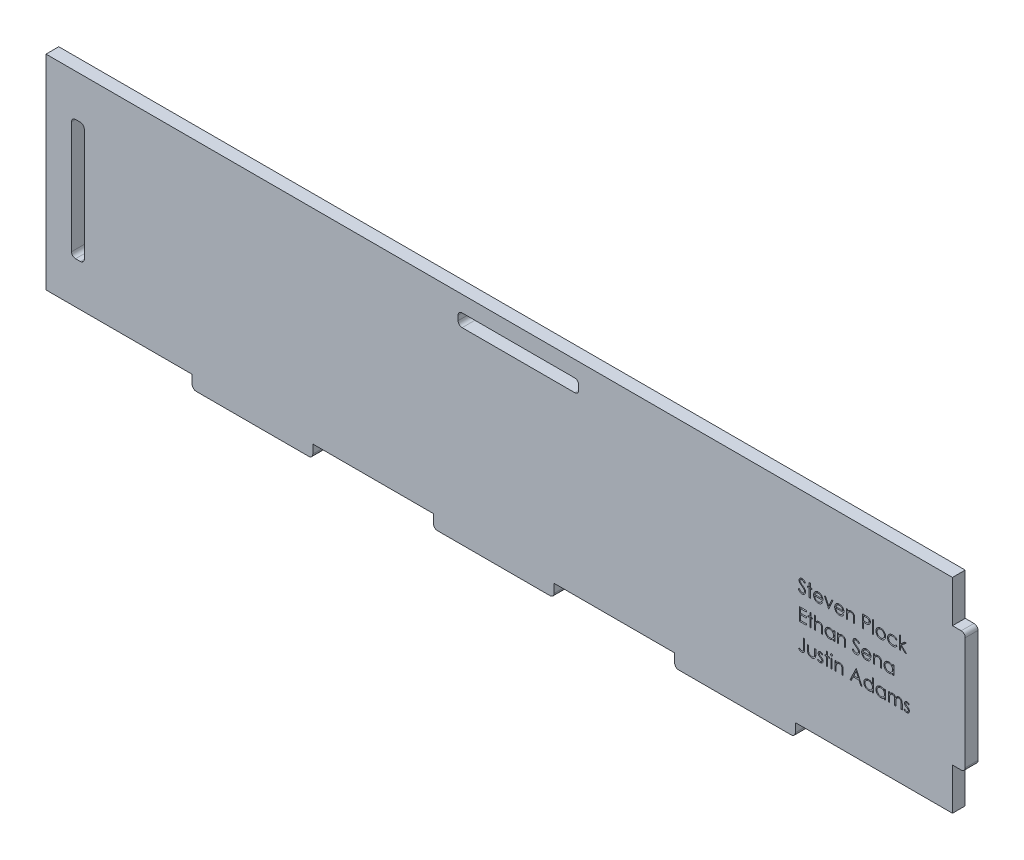
from build123d import *

# Parameters (mm, degrees)
SKETCH1_W           = 225.43
SKETCH1_H           = 50.8
BOSS_EXTRUDE1_DEPTH = 3.175
SKETCH2_W           = 3.175
SKETCH2_H           = 30
CUT_EXTRUDE1_DEPTH  = 10
SKETCH4_W           = 3.175
SKETCH4_H           = 30
BOSS_EXTRUDE2_DEPTH = 3.175
SKETCH5_W           = 30
SKETCH5_H           = 3.175
BOSS_EXTRUDE3_DEPTH = 3.175
SKETCH6_W           = 30
SKETCH6_H           = 3.175
CUT_EXTRUDE2_DEPTH  = 10
FILLET1_R           = 1
SKETCH7_W           = 0.284935898
SKETCH7_H           = 3.256410257
SKETCH7_H_2         = 2.320192308
CUT_EXTRUDE3_DEPTH  = 2


with BuildPart() as part:
    # Sketch1 → Boss-Extrude1 (new body)
    with BuildSketch(Plane.XY):
        Rectangle(SKETCH1_W, SKETCH1_H)
    extrude(amount=BOSS_EXTRUDE1_DEPTH)

    # Sketch2 → Cut-Extrude1 (cut)
    with BuildSketch(Plane.XY.offset(3.175)):
        with Locations((-104.7775, 0)):
            Rectangle(SKETCH2_W, SKETCH2_H)
    extrude(amount=-CUT_EXTRUDE1_DEPTH, mode=Mode.SUBTRACT)

    # Sketch4 → Boss-Extrude2 (add)
    with BuildSketch(Plane(origin=(112.715, 0, 0), x_dir=(0, 0, -1), z_dir=(1, 0, 0))):
        with Locations((-1.5875, 0)):
            Rectangle(SKETCH4_W, SKETCH4_H)
    extrude(amount=BOSS_EXTRUDE2_DEPTH)

    # Sketch5 → Boss-Extrude3 (add)
    with BuildSketch(Plane.XZ.offset(25.4)):
        with Locations((-61.365, 1.5875)):
            Rectangle(SKETCH5_W, SKETCH5_H)
        with Locations((-1.365, 1.5875)):
            Rectangle(SKETCH5_W, SKETCH5_H)
        with Locations((58.635, 1.5875)):
            Rectangle(SKETCH5_W, SKETCH5_H)
    extrude(amount=BOSS_EXTRUDE3_DEPTH)

    # Sketch6 → Cut-Extrude2 (cut)
    with BuildSketch(Plane.XY.offset(3.175)):
        with Locations((4.77, 19.8125)):
            Rectangle(SKETCH6_W, SKETCH6_H)
    extrude(amount=-CUT_EXTRUDE2_DEPTH, mode=Mode.SUBTRACT)

    # Fillet1
    fillet1_edges = [part.edges().sort_by_distance(p)[0] for p in [
        (115.89, -15, 1.5875),
        (115.89, 15, 1.5875),
        (73.635, -28.575, 1.5875),
        (-76.365, -28.575, 1.5875),
        (-46.365, -28.575, 1.5875),
        (-16.365, -28.575, 1.5875),
        (43.635, -28.575, 1.5875),
        (13.635, -28.575, 1.5875),
        (-10.23, 21.4, 1.5875),
        (-10.23, 18.225, 1.5875),
        (19.77, 18.225, 1.5875),
        (19.77, 21.4, 1.5875),
        (-103.19, 15, 1.5875),
        (-106.365, 15, 1.5875),
        (-106.365, -15, 1.5875),
        (-103.19, -15, 1.5875),
    ]]
    fillet(fillet1_edges, radius=FILLET1_R)

    # Sketch7 → Cut-Extrude3 (cut)
    # profile 1 of 32: a face of its own
    with BuildSketch(Plane.XY.offset(3.175)):
        with BuildLine():
            Line((74.342005604, 3.828799753), (74.610405043, 3.989712213))
            add(Edge.make_bspline(
                [(74.610405043, 3.989712213), (74.635368015, 3.947925235), (74.683196107, 3.867862999), (74.762980554, 3.759678919), (74.845651124, 3.667728962), (74.931820019, 3.59254804), (75.020961272, 3.533357978), (75.113656807, 3.491445954), (75.209594249, 3.465305748), (75.274884787, 3.462130669), (75.307480364, 3.460545546)],
                knots=[0, 0, 0, 0, 1.272034388, 2.437168799, 3.508375237, 4.49857839, 5.41946034, 6.295179144, 7.148887113, 8, 8, 8, 8], degree=3))
            add(Edge.make_bspline(
                [(75.307480364, 3.460545546), (75.33531773, 3.461320857), (75.390505374, 3.462857911), (75.471751123, 3.477626924), (75.550656044, 3.500316498), (75.625593879, 3.5328112), (75.695530615, 3.572125398), (75.756859546, 3.619610859), (75.80987852, 3.67277506), (75.853248217, 3.732086468), (75.886522249, 3.795874167), (75.912096482, 3.861348066), (75.926288799, 3.929536695), (75.928426711, 3.975447615), (75.929505604, 3.99861646)],
                knots=[0, 0, 0, 0, 1.095163259, 2.171163733, 3.241058638, 4.321873601, 5.38011039, 6.391990106, 7.366004449, 8.327778327, 9.272591725, 10.192022065, 11.087607919, 12, 12, 12, 12], degree=3))
            add(Edge.make_bspline(
                [(75.929505604, 3.99861646), (75.928168194, 4.025051374), (75.925449434, 4.07878969), (75.902470162, 4.158073661), (75.866321203, 4.236534778), (75.832972233, 4.285068069), (75.815658449, 4.310265098)],
                knots=[0, 0, 0, 0, 0.938893495, 1.908633276, 2.914225137, 4, 4, 4, 4], degree=3))
            add(Edge.make_bspline(
                [(75.815658449, 4.310265098), (75.801442963, 4.328450431), (75.771599329, 4.366628262), (75.720293585, 4.42345644), (75.660090039, 4.482074577), (75.593048957, 4.544721007), (75.516728226, 4.60848208), (75.433518267, 4.676398304), (75.341294623, 4.745886877), (75.276615794, 4.792489133), (75.243242583, 4.81653513)],
                knots=[0, 0, 0, 0, 0.722233717, 1.516239348, 2.393582979, 3.351407094, 4.387010283, 5.505090956, 6.712668013, 8, 8, 8, 8], degree=3))
            add(Edge.make_bspline(
                [(75.243242583, 4.81653513), (75.209837958, 4.840328206), (75.145970859, 4.885818755), (75.056654859, 4.953332213), (74.976785953, 5.015057723), (74.906719131, 5.071576362), (74.846485211, 5.122895797), (74.795609545, 5.168523213), (74.75538814, 5.209692586), (74.733022006, 5.236400089), (74.722980163, 5.248391099)],
                knots=[0, 0, 0, 0, 1.452282411, 2.77665338, 3.964542531, 5.026858415, 5.96415736, 6.766646006, 7.446254459, 8, 8, 8, 8], degree=3))
            add(Edge.make_bspline(
                [(74.722980163, 5.248391099), (74.708944354, 5.267079183), (74.681341052, 5.303831807), (74.644904748, 5.361276499), (74.61393565, 5.420080461), (74.589658391, 5.48040171), (74.569214821, 5.541393396), (74.555464413, 5.603851311), (74.54685436, 5.667495201), (74.545972629, 5.710324591), (74.545531245, 5.731764497)],
                knots=[0, 0, 0, 0, 1.068054152, 2.10047183, 3.106115577, 4.101338837, 5.06977816, 6.043150881, 7.020423561, 8, 8, 8, 8], degree=3))
            add(Edge.make_bspline(
                [(74.545531245, 5.731764497), (74.546715256, 5.765355792), (74.549057971, 5.831820393), (74.56887044, 5.928912646), (74.600142279, 6.021610325), (74.643952642, 6.108995699), (74.700428955, 6.18879341), (74.765784946, 6.261921359), (74.843628222, 6.323397144), (74.929038102, 6.37711094), (75.022524954, 6.419153315), (75.120488131, 6.450867919), (75.223083332, 6.468837745), (75.292573318, 6.471416539), (75.327832928, 6.472725034)],
                knots=[0, 0, 0, 0, 1.005424448, 1.989358655, 2.955360095, 3.929531133, 4.905563448, 5.876582895, 6.856512386, 7.866279853, 8.892233794, 9.918561126, 10.94386622, 12, 12, 12, 12], degree=3))
            add(Edge.make_bspline(
                [(75.327832928, 6.472725034), (75.365247219, 6.471434576), (75.439652302, 6.468868268), (75.549098376, 6.446554793), (75.65447274, 6.409633469), (75.739239131, 6.367733758), (75.805580993, 6.325885974), (75.856174829, 6.287767991), (75.907444231, 6.243884856), (75.959802752, 6.194119683), (76.012363207, 6.138015845), (76.06590591, 6.075957577), (76.120556068, 6.00832413), (76.15571317, 5.960041904), (76.173736373, 5.935290138)],
                knots=[0, 0, 0, 0, 1.286793592, 2.559021753, 3.825965368, 5.121522368, 5.803751409, 6.523245864, 7.299691795, 8.125521123, 9.008227632, 9.944561021, 10.946284179, 12, 12, 12, 12], degree=3))
            Line((76.173736373, 5.935290138), (75.916149234, 5.740032726))
            add(Edge.make_bspline(
                [(75.916149234, 5.740032726), (75.900595424, 5.760070324), (75.870642422, 5.798658052), (75.825167816, 5.852697745), (75.782306542, 5.902061266), (75.74007868, 5.944937489), (75.700714457, 5.983674425), (75.662508283, 6.016839347), (75.626009979, 6.044757208), (75.580002495, 6.074551009), (75.522201422, 6.104084409), (75.449644022, 6.129075358), (75.373819329, 6.144093165), (75.322176021, 6.146078798), (75.296032046, 6.147084008)],
                knots=[0, 0, 0, 0, 1.181633172, 2.275549214, 3.290209073, 4.226197932, 5.078386478, 5.862611352, 6.581680152, 7.217281963, 8.414376989, 9.595101626, 10.782541182, 12, 12, 12, 12], degree=3))
            add(Edge.make_bspline(
                [(75.296032046, 6.147084008), (75.263232915, 6.145984823), (75.199982881, 6.143865148), (75.110184595, 6.120714876), (75.029363677, 6.084264188), (74.959919565, 6.033178458), (74.902101021, 5.972652986), (74.860276784, 5.903003596), (74.83510342, 5.826093845), (74.832031581, 5.772443914), (74.830467142, 5.745120867)],
                knots=[0, 0, 0, 0, 1.14458467, 2.207223713, 3.21896685, 4.227309161, 5.202851033, 6.127160689, 7.046193047, 8, 8, 8, 8], degree=3))
            add(Edge.make_bspline(
                [(74.830467142, 5.745120867), (74.830823764, 5.728110597), (74.831537592, 5.694062242), (74.841493301, 5.643759881), (74.854283407, 5.593584595), (74.874551365, 5.543761966), (74.902532462, 5.493420654), (74.939276443, 5.441693792), (74.985552805, 5.388125457), (75.021001237, 5.353284482), (75.039716942, 5.334889497)],
                knots=[0, 0, 0, 0, 0.858281714, 1.717966888, 2.583508476, 3.4729293, 4.427298488, 5.488583878, 6.674047936, 8, 8, 8, 8], degree=3))
            add(Edge.make_bspline(
                [(75.039716942, 5.334889497), (75.046666901, 5.328687338), (75.063178414, 5.313952427), (75.093364432, 5.28982943), (75.133226828, 5.260072629), (75.181724681, 5.223254135), (75.239752217, 5.180544523), (75.307315814, 5.132489889), (75.383662347, 5.077530223), (75.437838657, 5.039105882), (75.466484771, 5.018788736)],
                knots=[0, 0, 0, 0, 0.420754252, 0.999615792, 1.744751191, 2.668019286, 3.750313428, 4.999500688, 6.413464383, 8, 8, 8, 8], degree=3))
            add(Edge.make_bspline(
                [(75.466484771, 5.018788736), (75.500943421, 4.993714074), (75.56766782, 4.945160466), (75.662607196, 4.872211956), (75.748689437, 4.800867195), (75.826216771, 4.731581794), (75.89595511, 4.66488131), (75.957130756, 4.599963282), (76.010367052, 4.537292798), (76.067679629, 4.456944819), (76.126242794, 4.358264835), (76.176536161, 4.237362433), (76.208248376, 4.115990057), (76.212395394, 4.034413569), (76.214441501, 3.994164337)],
                knots=[0, 0, 0, 0, 1.163667725, 2.253281268, 3.268753668, 4.215851969, 5.092017293, 5.902905408, 6.650798638, 7.335211899, 8.59617414, 9.77448103, 10.901945474, 12, 12, 12, 12], degree=3))
            add(Edge.make_bspline(
                [(76.214441501, 3.994164337), (76.213845383, 3.965699677), (76.212664723, 3.909323122), (76.199093037, 3.82654173), (76.179208769, 3.74614087), (76.149239279, 3.669114361), (76.112660414, 3.594053041), (76.066245317, 3.522925874), (76.012444775, 3.454158641), (75.950728431, 3.389585045), (75.883195362, 3.33030671), (75.811818011, 3.277575347), (75.736479549, 3.233607654), (75.657588676, 3.19772939), (75.57512727, 3.16966827), (75.489123067, 3.149336596), (75.399434296, 3.136858201), (75.338473859, 3.135563018), (75.307480364, 3.134904521)],
                knots=[0, 0, 0, 0, 0.983748083, 1.948392443, 2.894712957, 3.844097841, 4.80183111, 5.778335162, 6.776009319, 7.81870978, 8.863265674, 9.881300176, 10.883814829, 11.87499822, 12.874611388, 13.892143829, 14.928324115, 16, 16, 16, 16], degree=3))
            add(Edge.make_bspline(
                [(75.307480364, 3.134904521), (75.283499731, 3.135368236), (75.235840477, 3.136289825), (75.165346876, 3.144437129), (75.096277391, 3.155964288), (75.029498721, 3.174265051), (74.964150498, 3.196469166), (74.900516935, 3.223808939), (74.838567193, 3.2565724), (74.7779541, 3.294032887), (74.718831813, 3.337628127), (74.661754867, 3.388404084), (74.604850535, 3.444960364), (74.549798397, 3.508832803), (74.495484902, 3.578989493), (74.442980916, 3.656086824), (74.391199643, 3.739704852), (74.358709898, 3.798546751), (74.342005604, 3.828799753)],
                knots=[0, 0, 0, 0, 0.915332311, 1.819136955, 2.706846663, 3.586547465, 4.459518054, 5.340707479, 6.227863349, 7.133153174, 8.059268498, 9.028702269, 10.047606654, 11.120612155, 12.245963614, 13.433783089, 14.680604001, 16, 16, 16, 16], degree=3))
        make_face()
    # profile 2 of 32: a face of its own
    with BuildSketch(Plane.XY.offset(3.175)):
        Polygon((77.069249194, 6.472725034), (77.354185091, 6.472725034), (77.354185091, 5.536507085), (77.761236373, 5.536507085), (77.761236373, 5.251571187), (77.354185091, 5.251571187), (77.354185091, 3.216314777), (77.069249194, 3.216314777), (77.069249194, 5.251571187), (76.662197912, 5.251571187), (76.662197912, 5.536507085), (77.069249194, 5.536507085), align=None)
    # profile 3 of 32: a face of its own
    with BuildSketch(Plane.XY.offset(3.175)):
        with BuildLine():
            Line((80.15393469, 3.949007085), (80.407069707, 3.816079401))
            add(Edge.make_bspline(
                [(80.407069707, 3.816079401), (80.386897938, 3.780298664), (80.347651665, 3.710683521), (80.280159558, 3.615041762), (80.209409606, 3.529001334), (80.132208149, 3.454860862), (80.050864941, 3.390225677), (79.964928889, 3.333676365), (79.873952605, 3.285490278), (79.777931783, 3.244893342), (79.676060047, 3.213679015), (79.568090529, 3.191631615), (79.453816387, 3.178003364), (79.375488066, 3.176420272), (79.335380003, 3.175609649)],
                knots=[0, 0, 0, 0, 1.120438281, 2.179929193, 3.190490725, 4.156257408, 5.095198341, 6.022838206, 6.959905092, 7.901321166, 8.864066838, 9.862729781, 10.905609505, 12, 12, 12, 12], degree=3))
            add(Edge.make_bspline(
                [(79.335380003, 3.175609649), (79.290801209, 3.176650301), (79.203840897, 3.178680311), (79.077258412, 3.196181333), (78.958078511, 3.224731258), (78.846307894, 3.264614285), (78.742220279, 3.316709072), (78.64560879, 3.380172316), (78.555965363, 3.454678004), (78.47611483, 3.540871492), (78.404229308, 3.633111553), (78.3407966, 3.729228677), (78.287767359, 3.828981031), (78.244630348, 3.931733578), (78.209791649, 4.036838681), (78.185510425, 4.145252655), (78.171513439, 4.256682078), (78.169368549, 4.332063233), (78.168287655, 4.370050755)],
                knots=[0, 0, 0, 0, 1.145258523, 2.234067595, 3.276747158, 4.290159414, 5.277019952, 6.260822364, 7.254936242, 8.264827045, 9.274100331, 10.257902744, 11.220704747, 12.172965371, 13.118907548, 14.062713208, 15.023725156, 16, 16, 16, 16], degree=3))
            add(Edge.make_bspline(
                [(78.168287655, 4.370050755), (78.169248448, 4.40569678), (78.171152612, 4.476342493), (78.183154826, 4.580904809), (78.204425777, 4.682530619), (78.2336143, 4.781304368), (78.271307216, 4.877060676), (78.317419301, 4.969857819), (78.372022386, 5.059597053), (78.41417974, 5.11620561), (78.435415059, 5.144720226)],
                knots=[0, 0, 0, 0, 1.024358464, 2.0301432, 3.019427413, 4.004406732, 4.986367066, 5.972626655, 6.978780325, 8, 8, 8, 8], degree=3))
            add(Edge.make_bspline(
                [(78.435415059, 5.144720226), (78.464178457, 5.179072701), (78.520794101, 5.246689452), (78.616548795, 5.335533504), (78.720235402, 5.409958929), (78.83055452, 5.471651117), (78.948788321, 5.518526497), (79.073347464, 5.553458375), (79.205650246, 5.573032713), (79.296097125, 5.575797534), (79.342376197, 5.577212213)],
                knots=[0, 0, 0, 0, 1.030682036, 2.02871468, 2.997146059, 3.962720338, 4.930598197, 5.918074684, 6.934738563, 8, 8, 8, 8], degree=3))
            add(Edge.make_bspline(
                [(79.342376197, 5.577212213), (79.389953667, 5.575983897), (79.483289819, 5.573574222), (79.619390386, 5.551234619), (79.748169036, 5.515808373), (79.869574236, 5.465776006), (79.983618296, 5.401224127), (80.089559926, 5.321266885), (80.189210941, 5.228359049), (80.247185152, 5.156909566), (80.276686093, 5.120551556)],
                knots=[0, 0, 0, 0, 1.056321875, 2.072262726, 3.055038591, 4.01806755, 4.982017516, 5.957941055, 6.960871419, 8, 8, 8, 8], degree=3))
            add(Edge.make_bspline(
                [(80.276686093, 5.120551556), (80.296758387, 5.093152593), (80.336769368, 5.038537042), (80.38688638, 4.949481778), (80.430390588, 4.856308596), (80.46516406, 4.757511398), (80.493321322, 4.654260779), (80.513692864, 4.545818614), (80.52563959, 4.432217194), (80.527987908, 4.354813819), (80.529185091, 4.315353239)],
                knots=[0, 0, 0, 0, 0.94817472, 1.890038105, 2.849395472, 3.817997239, 4.812318967, 5.836947057, 6.897266129, 8, 8, 8, 8], degree=3))
            Line((80.529185091, 4.315353239), (78.453223553, 4.315353239))
            add(Edge.make_bspline(
                [(78.453223553, 4.315353239), (78.454620196, 4.284782103), (78.457366638, 4.224665198), (78.470171089, 4.136698845), (78.490353905, 4.052903028), (78.518719412, 3.973906268), (78.55307005, 3.898676795), (78.595148522, 3.827772662), (78.645349403, 3.761516825), (78.70134343, 3.699316636), (78.763670581, 3.643925803), (78.829241359, 3.594348834), (78.898994807, 3.552796615), (78.972380926, 3.519069143), (79.049281045, 3.492665556), (79.129719394, 3.474642605), (79.213537685, 3.462571158), (79.270674744, 3.46122889), (79.299763016, 3.460545546)],
                knots=[0, 0, 0, 0, 1.094153842, 2.151609401, 3.174256925, 4.172055639, 5.149267565, 6.128595816, 7.11444997, 8.118368179, 9.117203808, 10.09244225, 11.054858984, 12.015122123, 12.976791628, 13.957293641, 14.960065497, 16, 16, 16, 16], degree=3))
            add(Edge.make_bspline(
                [(79.299763016, 3.460545546), (79.328202985, 3.461097141), (79.384633341, 3.46219161), (79.468671833, 3.472834129), (79.551348404, 3.490042879), (79.632320867, 3.513528798), (79.709945849, 3.542173514), (79.781832884, 3.576738249), (79.847945651, 3.614974091), (79.909737471, 3.658707153), (79.9696733, 3.712236009), (80.029129699, 3.779034127), (80.092880663, 3.858034956), (80.132785508, 3.917494239), (80.15393469, 3.949007085)],
                knots=[0, 0, 0, 0, 0.99110716, 1.966546729, 2.947904876, 3.932708344, 4.903319531, 5.828989031, 6.710028674, 7.56322171, 8.463672341, 9.504779593, 10.677557249, 12, 12, 12, 12], degree=3))
        make_face()
        with BuildLine():
            add(Edge.make_bspline(
                [(80.244249194, 4.600289136), (80.233820113, 4.638083314), (80.213747489, 4.710824942), (80.171804502, 4.811554892), (80.124568175, 4.901078917), (80.068668462, 4.97871187), (80.005332904, 5.047657914), (79.932176202, 5.107909059), (79.850137927, 5.161809175), (79.759642136, 5.207304657), (79.663809945, 5.246030457), (79.563474328, 5.271997526), (79.461096192, 5.289786183), (79.391850089, 5.291442724), (79.357004602, 5.292276316)],
                knots=[0, 0, 0, 0, 1.154881502, 2.222775134, 3.210006277, 4.132804581, 5.035138423, 5.962687519, 6.919655026, 7.923214229, 8.944639381, 9.960483929, 10.97369054, 12, 12, 12, 12], degree=3))
            add(Edge.make_bspline(
                [(79.357004602, 5.292276316), (79.328566183, 5.291721442), (79.272349407, 5.290624574), (79.189526295, 5.280219528), (79.109988283, 5.26302024), (79.033148486, 5.239466315), (78.960013841, 5.208071369), (78.889080016, 5.171256585), (78.822150656, 5.126315291), (78.78029391, 5.092062615), (78.759148032, 5.074758287)],
                knots=[0, 0, 0, 0, 1.04873581, 2.073130211, 3.073294108, 4.04793562, 5.032784715, 6.005352987, 6.992311501, 8, 8, 8, 8], degree=3))
            add(Edge.make_bspline(
                [(78.759148032, 5.074758287), (78.74400484, 5.061065586), (78.713358711, 5.033354897), (78.67240981, 4.985612689), (78.633202667, 4.934130914), (78.597521425, 4.87693998), (78.5647939, 4.81469113), (78.534168778, 4.747909418), (78.506603961, 4.676088079), (78.491095347, 4.626038795), (78.483116381, 4.600289136)],
                knots=[0, 0, 0, 0, 0.879870761, 1.780643979, 2.707998968, 3.669668524, 4.684282772, 5.740141944, 6.837334558, 8, 8, 8, 8], degree=3))
            Line((78.483116381, 4.600289136), (80.244249194, 4.600289136))
        make_face(mode=Mode.SUBTRACT)
    # profile 4 of 32: a face of its own
    with BuildSketch(Plane.XY.offset(3.175)):
        Polygon((80.854826117, 5.536507085), (81.163294666, 5.536507085), (81.933512014, 3.847244264), (82.703729362, 5.536507085), (83.012197912, 5.536507085), (81.953864578, 3.216314777), (81.91315945, 3.216314777), align=None)
    # profile 5 of 32: a face of its own
    with BuildSketch(Plane.XY.offset(3.175)):
        with BuildLine():
            Line((85.404896229, 3.949007085), (85.658031245, 3.816079401))
            add(Edge.make_bspline(
                [(85.658031245, 3.816079401), (85.637859476, 3.780298664), (85.598613203, 3.710683521), (85.531121096, 3.615041762), (85.460371144, 3.529001334), (85.383169688, 3.454860862), (85.301826479, 3.390225677), (85.215890428, 3.333676365), (85.124914143, 3.285490278), (85.028893321, 3.244893342), (84.927021586, 3.213679015), (84.819052067, 3.191631615), (84.704777925, 3.178003364), (84.626449605, 3.176420272), (84.586341541, 3.175609649)],
                knots=[0, 0, 0, 0, 1.120438281, 2.179929193, 3.190490725, 4.156257408, 5.095198341, 6.022838206, 6.959905092, 7.901321166, 8.864066838, 9.862729781, 10.905609505, 12, 12, 12, 12], degree=3))
            add(Edge.make_bspline(
                [(84.586341541, 3.175609649), (84.541762748, 3.176650301), (84.454802435, 3.178680311), (84.32821995, 3.196181333), (84.209040049, 3.224731258), (84.097269433, 3.264614285), (83.993181818, 3.316709072), (83.896570328, 3.380172316), (83.806926901, 3.454678004), (83.727076368, 3.540871492), (83.655190846, 3.633111553), (83.591758138, 3.729228677), (83.538728897, 3.828981031), (83.495591887, 3.931733578), (83.460753188, 4.036838681), (83.436471963, 4.145252655), (83.422474978, 4.256682078), (83.420330088, 4.332063233), (83.419249194, 4.370050755)],
                knots=[0, 0, 0, 0, 1.145258523, 2.234067595, 3.276747158, 4.290159414, 5.277019952, 6.260822364, 7.254936242, 8.264827045, 9.274100331, 10.257902744, 11.220704747, 12.172965371, 13.118907548, 14.062713208, 15.023725156, 16, 16, 16, 16], degree=3))
            add(Edge.make_bspline(
                [(83.419249194, 4.370050755), (83.420209986, 4.40569678), (83.42211415, 4.476342493), (83.434116364, 4.580904809), (83.455387316, 4.682530619), (83.484575838, 4.781304368), (83.522268754, 4.877060676), (83.568380839, 4.969857819), (83.622983925, 5.059597053), (83.665141279, 5.11620561), (83.686376598, 5.144720226)],
                knots=[0, 0, 0, 0, 1.024358464, 2.0301432, 3.019427413, 4.004406732, 4.986367066, 5.972626655, 6.978780325, 8, 8, 8, 8], degree=3))
            add(Edge.make_bspline(
                [(83.686376598, 5.144720226), (83.715139995, 5.179072701), (83.77175564, 5.246689452), (83.867510334, 5.335533504), (83.97119694, 5.409958929), (84.081516058, 5.471651117), (84.19974986, 5.518526497), (84.324309002, 5.553458375), (84.456611784, 5.573032713), (84.547058663, 5.575797534), (84.593337735, 5.577212213)],
                knots=[0, 0, 0, 0, 1.030682036, 2.02871468, 2.997146059, 3.962720338, 4.930598197, 5.918074684, 6.934738563, 8, 8, 8, 8], degree=3))
            add(Edge.make_bspline(
                [(84.593337735, 5.577212213), (84.640915206, 5.575983897), (84.734251358, 5.573574222), (84.870351925, 5.551234619), (84.999130575, 5.515808373), (85.120535775, 5.465776006), (85.234579834, 5.401224127), (85.340521465, 5.321266885), (85.44017248, 5.228359049), (85.498146691, 5.156909566), (85.527647631, 5.120551556)],
                knots=[0, 0, 0, 0, 1.056321875, 2.072262726, 3.055038591, 4.01806755, 4.982017516, 5.957941055, 6.960871419, 8, 8, 8, 8], degree=3))
            add(Edge.make_bspline(
                [(85.527647631, 5.120551556), (85.547719925, 5.093152593), (85.587730906, 5.038537042), (85.637847918, 4.949481778), (85.681352127, 4.856308596), (85.716125598, 4.757511398), (85.74428286, 4.654260779), (85.764654403, 4.545818614), (85.776601128, 4.432217194), (85.778949447, 4.354813819), (85.78014663, 4.315353239)],
                knots=[0, 0, 0, 0, 0.94817472, 1.890038105, 2.849395472, 3.817997239, 4.812318967, 5.836947057, 6.897266129, 8, 8, 8, 8], degree=3))
            Line((85.78014663, 4.315353239), (83.704185091, 4.315353239))
            add(Edge.make_bspline(
                [(83.704185091, 4.315353239), (83.705581734, 4.284782103), (83.708328176, 4.224665198), (83.721132627, 4.136698845), (83.741315444, 4.052903028), (83.769680951, 3.973906268), (83.804031589, 3.898676795), (83.84611006, 3.827772662), (83.896310941, 3.761516825), (83.952304969, 3.699316636), (84.01463212, 3.643925803), (84.080202897, 3.594348834), (84.149956346, 3.552796615), (84.223342464, 3.519069143), (84.300242584, 3.492665556), (84.380680932, 3.474642605), (84.464499223, 3.462571158), (84.521636282, 3.46122889), (84.550724554, 3.460545546)],
                knots=[0, 0, 0, 0, 1.094153842, 2.151609401, 3.174256925, 4.172055639, 5.149267565, 6.128595816, 7.11444997, 8.118368179, 9.117203808, 10.09244225, 11.054858984, 12.015122123, 12.976791628, 13.957293641, 14.960065497, 16, 16, 16, 16], degree=3))
            add(Edge.make_bspline(
                [(84.550724554, 3.460545546), (84.579164524, 3.461097141), (84.635594879, 3.46219161), (84.719633371, 3.472834129), (84.802309943, 3.490042879), (84.883282406, 3.513528798), (84.960907388, 3.542173514), (85.032794422, 3.576738249), (85.098907189, 3.614974091), (85.160699009, 3.658707153), (85.220634839, 3.712236009), (85.280091237, 3.779034127), (85.343842201, 3.858034956), (85.383747046, 3.917494239), (85.404896229, 3.949007085)],
                knots=[0, 0, 0, 0, 0.99110716, 1.966546729, 2.947904876, 3.932708344, 4.903319531, 5.828989031, 6.710028674, 7.56322171, 8.463672341, 9.504779593, 10.677557249, 12, 12, 12, 12], degree=3))
        make_face()
        with BuildLine():
            add(Edge.make_bspline(
                [(85.495210732, 4.600289136), (85.484781651, 4.638083314), (85.464709028, 4.710824942), (85.42276604, 4.811554892), (85.375529714, 4.901078917), (85.31963, 4.97871187), (85.256294442, 5.047657914), (85.183137741, 5.107909059), (85.101099466, 5.161809175), (85.010603674, 5.207304657), (84.914771483, 5.246030457), (84.814435866, 5.271997526), (84.71205773, 5.289786183), (84.642811628, 5.291442724), (84.607966141, 5.292276316)],
                knots=[0, 0, 0, 0, 1.154881502, 2.222775134, 3.210006277, 4.132804581, 5.035138423, 5.962687519, 6.919655026, 7.923214229, 8.944639381, 9.960483929, 10.97369054, 12, 12, 12, 12], degree=3))
            add(Edge.make_bspline(
                [(84.607966141, 5.292276316), (84.579527722, 5.291721442), (84.523310946, 5.290624574), (84.440487834, 5.280219528), (84.360949821, 5.26302024), (84.284110025, 5.239466315), (84.21097538, 5.208071369), (84.140041554, 5.171256585), (84.073112195, 5.126315291), (84.031255448, 5.092062615), (84.01010957, 5.074758287)],
                knots=[0, 0, 0, 0, 1.04873581, 2.073130211, 3.073294108, 4.04793562, 5.032784715, 6.005352987, 6.992311501, 8, 8, 8, 8], degree=3))
            add(Edge.make_bspline(
                [(84.01010957, 5.074758287), (83.994966379, 5.061065586), (83.96432025, 5.033354897), (83.923371348, 4.985612689), (83.884164205, 4.934130914), (83.848482963, 4.87693998), (83.815755438, 4.81469113), (83.785130316, 4.747909418), (83.757565499, 4.676088079), (83.742056885, 4.626038795), (83.73407792, 4.600289136)],
                knots=[0, 0, 0, 0, 0.879870761, 1.780643979, 2.707998968, 3.669668524, 4.684282772, 5.740141944, 6.837334558, 8, 8, 8, 8], degree=3))
            Line((83.73407792, 4.600289136), (85.495210732, 4.600289136))
        make_face(mode=Mode.SUBTRACT)
    # profile 6 of 32: a face of its own
    with BuildSketch(Plane.XY.offset(3.175)):
        with BuildLine():
            Line((86.350018424, 5.536507085), (86.634954322, 5.536507085))
            Line((86.634954322, 5.536507085), (86.634954322, 5.118007486))
            add(Edge.make_bspline(
                [(86.634954322, 5.118007486), (86.665377748, 5.155964813), (86.724415468, 5.22962233), (86.822735542, 5.326433137), (86.926643223, 5.40621202), (87.035502183, 5.469806176), (87.149460199, 5.517745615), (87.26782263, 5.552367567), (87.391298113, 5.573127376), (87.475267281, 5.575839942), (87.51774679, 5.577212213)],
                knots=[0, 0, 0, 0, 1.12780773, 2.188550248, 3.19190651, 4.159438251, 5.104880172, 6.052711206, 7.014878035, 8, 8, 8, 8], degree=3))
            add(Edge.make_bspline(
                [(87.51774679, 5.577212213), (87.560682437, 5.575629072), (87.644717854, 5.572530482), (87.767071524, 5.548022483), (87.881347388, 5.506162145), (87.987137985, 5.448819766), (88.082503386, 5.377512466), (88.166255215, 5.294438335), (88.23552759, 5.19888346), (88.281970912, 5.110234596), (88.312564892, 5.031595476), (88.331825655, 4.964243067), (88.348182332, 4.889205887), (88.36236256, 4.806710688), (88.371957512, 4.716179473), (88.379525162, 4.617983352), (88.384948692, 4.512154134), (88.385163872, 4.438959836), (88.385274835, 4.401215619)],
                knots=[0, 0, 0, 0, 1.235846778, 2.418850247, 3.575807741, 4.728682307, 5.871620074, 6.994088408, 8.11269785, 9.256955736, 9.865816715, 10.540099792, 11.271859618, 12.076849838, 12.949306005, 13.892391288, 14.913166135, 16, 16, 16, 16], degree=3))
            Line((88.385274835, 4.401215619), (88.385274835, 3.216314777))
            Line((88.385274835, 3.216314777), (88.100338937, 3.216314777))
            Line((88.100338937, 3.216314777), (88.100338937, 4.307721027))
            add(Edge.make_bspline(
                [(88.100338937, 4.307721027), (88.10016367, 4.339309959), (88.099828414, 4.399734211), (88.098771005, 4.486247539), (88.096222109, 4.564703221), (88.092640426, 4.63491369), (88.087398019, 4.696811527), (88.081934632, 4.7505228), (88.075253546, 4.795979313), (88.069300046, 4.823343352), (88.066630003, 4.835615659)],
                knots=[0, 0, 0, 0, 1.430800155, 2.736877192, 3.918605307, 4.986035426, 5.920637409, 6.731861385, 7.431261377, 8, 8, 8, 8], degree=3))
            add(Edge.make_bspline(
                [(88.066630003, 4.835615659), (88.056991128, 4.871639376), (88.038439276, 4.940973888), (87.992597734, 5.035021336), (87.934709156, 5.115029692), (87.864044678, 5.18050429), (87.781286874, 5.231459263), (87.686665394, 5.266814208), (87.581093342, 5.288926966), (87.506839723, 5.291128722), (87.468137415, 5.292276316)],
                knots=[0, 0, 0, 0, 1.084156227, 2.086665306, 3.027808233, 3.945421172, 4.874247719, 5.839848303, 6.874090471, 8, 8, 8, 8], degree=3))
            add(Edge.make_bspline(
                [(87.468137415, 5.292276316), (87.445216016, 5.291844511), (87.39985516, 5.290989982), (87.332590543, 5.282416305), (87.267345043, 5.268393277), (87.203463853, 5.249462442), (87.142224641, 5.223461669), (87.081659891, 5.193952883), (87.024050183, 5.157169862), (86.968167102, 5.116175513), (86.916176197, 5.070746517), (86.867799776, 5.022808998), (86.824676001, 4.971758986), (86.78560656, 4.918419033), (86.751880563, 4.86205658), (86.722440976, 4.803215388), (86.697462168, 4.74181801), (86.685050011, 4.699204919), (86.678839538, 4.677883287)],
                knots=[0, 0, 0, 0, 1.023777757, 2.026029729, 3.023749952, 4.003683103, 4.997618607, 5.993177895, 7.010360494, 8.046726602, 9.087585522, 10.09234134, 11.086953743, 12.070360549, 13.043493632, 14.017870808, 15.008233677, 16, 16, 16, 16], degree=3))
            add(Edge.make_bspline(
                [(86.678839538, 4.677883287), (86.675265714, 4.662230353), (86.667485686, 4.628154734), (86.659082659, 4.572234439), (86.651455787, 4.507546105), (86.64507226, 4.434165217), (86.641166632, 4.351834859), (86.636908144, 4.260906634), (86.635357781, 4.16101797), (86.635092574, 4.091474863), (86.634954322, 4.055222029)],
                knots=[0, 0, 0, 0, 0.615963638, 1.340920617, 2.168419149, 3.115676021, 4.16674242, 5.331190069, 6.6087489, 8, 8, 8, 8], degree=3))
            Line((86.634954322, 4.055222029), (86.634954322, 3.216314777))
            Line((86.634954322, 3.216314777), (86.350018424, 3.216314777))
            Line((86.350018424, 3.216314777), (86.350018424, 5.536507085))
        make_face()
    # profile 7 of 32: a face of its own
    with BuildSketch(Plane.XY.offset(3.175)):
        with BuildLine():
            Line((90.339120989, 6.391314777), (90.961782247, 6.391314777))
            add(Edge.make_bspline(
                [(90.961782247, 6.391314777), (91.004609283, 6.3912677), (91.086667786, 6.391177498), (91.204337873, 6.388442693), (91.311208129, 6.384789908), (91.407048118, 6.379726333), (91.492152721, 6.373742283), (91.566136843, 6.365349362), (91.629582012, 6.356586094), (91.667597148, 6.347676675), (91.68493429, 6.343613455)],
                knots=[0, 0, 0, 0, 1.415646017, 2.712440637, 3.8905458, 4.950247383, 5.884950622, 6.709939814, 7.411656543, 8, 8, 8, 8], degree=3))
            add(Edge.make_bspline(
                [(91.68493429, 6.343613455), (91.706881281, 6.337606401), (91.750258111, 6.32573384), (91.8127612, 6.301954248), (91.872227902, 6.273758284), (91.928862245, 6.24162371), (91.981968277, 6.204171806), (92.032338329, 6.162920738), (92.079527882, 6.116918101), (92.123271573, 6.066679858), (92.163444211, 6.013049382), (92.19803328, 5.955226074), (92.226995836, 5.894183248), (92.251836376, 5.829963366), (92.269714759, 5.762027144), (92.283183018, 5.690846626), (92.291731595, 5.616429443), (92.292550347, 5.565575135), (92.292967142, 5.539687173)],
                knots=[0, 0, 0, 0, 0.999701418, 1.975846123, 2.934577507, 3.890451536, 4.834027766, 5.787354733, 6.749476667, 7.726910423, 8.712836071, 9.690891519, 10.682875813, 11.679750201, 12.712814741, 13.765529915, 14.8625177, 16, 16, 16, 16], degree=3))
            add(Edge.make_bspline(
                [(92.292967142, 5.539687173), (92.29258485, 5.513581618), (92.291836869, 5.462504338), (92.282859524, 5.387780451), (92.270767136, 5.316371626), (92.252173382, 5.248436196), (92.227820521, 5.184377604), (92.19925273, 5.123216915), (92.164796242, 5.065994641), (92.125204147, 5.012503042), (92.081160915, 4.962691907), (92.032852892, 4.9169222), (91.980475105, 4.875461836), (91.924194014, 4.838217867), (91.863460937, 4.806053957), (91.799196983, 4.777245544), (91.730843572, 4.753051082), (91.683542863, 4.740323812), (91.659493585, 4.733852838)],
                knots=[0, 0, 0, 0, 1.121902311, 2.195077645, 3.232258892, 4.234102512, 5.217864754, 6.176164875, 7.132989551, 8.084763148, 9.034132444, 9.988522005, 10.94243251, 11.903244335, 12.886203696, 13.894208494, 14.929344452, 16, 16, 16, 16], degree=3))
            add(Edge.make_bspline(
                [(91.659493585, 4.733852838), (91.63960236, 4.729622848), (91.596009585, 4.720352579), (91.52421583, 4.710003479), (91.440626802, 4.701170084), (91.345356591, 4.694546909), (91.238490713, 4.688876932), (91.119971358, 4.684370161), (90.989565873, 4.681893794), (90.898605531, 4.681766075), (90.851115179, 4.681699393)],
                knots=[0, 0, 0, 0, 0.601384939, 1.31797006, 2.144135048, 3.087295005, 4.142315834, 5.309527816, 6.595305764, 8, 8, 8, 8], degree=3))
            Line((90.851115179, 4.681699393), (90.624056886, 4.681699393))
            Line((90.624056886, 4.681699393), (90.624056886, 3.216314777))
            Line((90.624056886, 3.216314777), (90.339120989, 3.216314777))
            Line((90.339120989, 3.216314777), (90.339120989, 6.391314777))
        make_face()
        with BuildLine():
            Line((90.624056886, 6.065673752), (90.624056886, 5.007340418))
            Line((90.624056886, 5.007340418), (91.179936293, 5.000344224))
            add(Edge.make_bspline(
                [(91.179936293, 5.000344224), (91.20707794, 5.000330197), (91.25947433, 5.000303116), (91.335162904, 5.003918283), (91.405384186, 5.008091624), (91.469922479, 5.014202069), (91.528806877, 5.022839209), (91.582135564, 5.031558429), (91.629495028, 5.044172579), (91.684920732, 5.061157078), (91.746682055, 5.090124522), (91.813871902, 5.132170493), (91.870813791, 5.185765136), (91.920088246, 5.246024669), (91.959191435, 5.313061736), (91.987817228, 5.384788557), (92.004636707, 5.460469535), (92.00689204, 5.512256632), (92.008031245, 5.538415138)],
                knots=[0, 0, 0, 0, 1.160613943, 2.240541288, 3.23993089, 4.169200891, 5.011653406, 5.7853311, 6.478053781, 7.106038997, 8.262395093, 9.384106736, 10.481365981, 11.59014053, 12.70357646, 13.786202915, 14.881775077, 16, 16, 16, 16], degree=3))
            add(Edge.make_bspline(
                [(92.008031245, 5.538415138), (92.006885844, 5.563940789), (92.004608929, 5.614682625), (91.987685396, 5.689049072), (91.95924709, 5.760020033), (91.919825751, 5.826217046), (91.871982012, 5.886259747), (91.81637475, 5.938417855), (91.753134863, 5.980347542), (91.694308254, 6.007410591), (91.642055749, 6.023934448), (91.596669614, 6.035495839), (91.545424502, 6.044726567), (91.488303731, 6.052200973), (91.425750032, 6.05859947), (91.357225989, 6.062941035), (91.282991184, 6.065482356), (91.23145588, 6.065608409), (91.204740981, 6.065673752)],
                knots=[0, 0, 0, 0, 1.120700087, 2.227813068, 3.331159281, 4.466773991, 5.599788987, 6.693661531, 7.80175334, 8.91857717, 9.525282508, 10.207424825, 10.974604443, 11.810962634, 12.737642355, 13.736264703, 14.826523623, 16, 16, 16, 16], degree=3))
            Line((91.204740981, 6.065673752), (90.624056886, 6.065673752))
        make_face(mode=Mode.SUBTRACT)
    # profile 8 of 32: a face of its own
    with BuildSketch(Plane.XY.offset(3.175)):
        with Locations((92.964601758, 4.844519906)):
            Rectangle(SKETCH7_W, SKETCH7_H)
    # profile 9 of 32: a face of its own
    with BuildSketch(Plane.XY.offset(3.175)):
        with BuildLine():
            add(Edge.make_bspline(
                [(94.879014819, 5.577212213), (94.922549759, 5.576285212), (95.007911138, 5.574467589), (95.132922577, 5.555041156), (95.252252808, 5.525334618), (95.366358853, 5.484266844), (95.47377935, 5.429219646), (95.576078978, 5.363534075), (95.672977265, 5.285717008), (95.731055299, 5.22552076), (95.760535251, 5.194965619)],
                knots=[0, 0, 0, 0, 1.054011418, 2.066658804, 3.057071809, 4.030435133, 4.997543892, 5.974964718, 6.972108034, 8, 8, 8, 8], degree=3))
            add(Edge.make_bspline(
                [(95.760535251, 5.194965619), (95.785918881, 5.165742931), (95.836194898, 5.107863097), (95.900661657, 5.014014076), (95.956198358, 4.916822699), (96.000705472, 4.814998339), (96.035798315, 4.709429887), (96.060713625, 4.599754491), (96.075533559, 4.486214362), (96.077531965, 4.409103738), (96.078544065, 4.370050755)],
                knots=[0, 0, 0, 0, 1.025258237, 2.030674902, 3.01204498, 3.988269485, 4.97094183, 5.956517959, 6.965070386, 8, 8, 8, 8], degree=3))
            add(Edge.make_bspline(
                [(96.078544065, 4.370050755), (96.077653852, 4.330771417), (96.07589475, 4.253153613), (96.059254469, 4.138836045), (96.033372698, 4.027987885), (95.996332388, 3.921073213), (95.948836103, 3.817765219), (95.890878122, 3.718515128), (95.822051727, 3.623127121), (95.744033815, 3.532411168), (95.657808185, 3.448803245), (95.564267107, 3.375934029), (95.465248805, 3.313503075), (95.359436621, 3.263214326), (95.247796829, 3.223563384), (95.130088632, 3.195714083), (95.006494889, 3.178875984), (94.92210591, 3.176713743), (94.879014819, 3.175609649)],
                knots=[0, 0, 0, 0, 0.998656419, 1.973391657, 2.932242238, 3.890759089, 4.846373663, 5.82037756, 6.809684879, 7.83454468, 8.860553229, 9.859544525, 10.845671541, 11.83227036, 12.833544569, 13.85385346, 14.904124723, 16, 16, 16, 16], degree=3))
            add(Edge.make_bspline(
                [(94.879014819, 3.175609649), (94.835712609, 3.176717448), (94.750903043, 3.17888713), (94.626873045, 3.195648665), (94.508953891, 3.223550549), (94.397167948, 3.263344631), (94.290900837, 3.313504682), (94.1913088, 3.375745286), (94.097691734, 3.448824855), (94.011447863, 3.532405313), (93.933434842, 3.62312863), (93.864607184, 3.718514736), (93.806649531, 3.817765321), (93.759153161, 3.921073185), (93.722112873, 4.027987892), (93.696231096, 4.138836043), (93.679590818, 4.253153613), (93.677831715, 4.330771417), (93.676941501, 4.370050755)],
                knots=[0, 0, 0, 0, 1.099876186, 2.154163076, 3.173186993, 4.173200201, 5.163417411, 6.152872554, 7.150605724, 8.17532212, 9.198891216, 10.186952605, 11.159729845, 12.11414092, 13.071450619, 14.029093627, 15.002601286, 16, 16, 16, 16], degree=3))
            add(Edge.make_bspline(
                [(93.676941501, 4.370050755), (93.677960504, 4.408891479), (93.679977955, 4.485789436), (93.694782988, 4.599116127), (93.719601107, 4.708605902), (93.754736017, 4.813766869), (93.799653369, 4.915145015), (93.85440968, 5.01257654), (93.91953404, 5.106001187), (93.969610096, 5.163806217), (93.994950315, 5.193057566)],
                knots=[0, 0, 0, 0, 1.031353054, 2.041901799, 3.029428768, 4.008703097, 4.981709435, 5.96992636, 6.972712378, 8, 8, 8, 8], degree=3))
            add(Edge.make_bspline(
                [(93.994950315, 5.193057566), (94.024385823, 5.223877689), (94.082275928, 5.284490885), (94.17965656, 5.362081103), (94.281704526, 5.429133542), (94.390312138, 5.483086966), (94.504324444, 5.525576193), (94.624266186, 5.555117767), (94.749701832, 5.574397596), (94.835480917, 5.576264657), (94.879014819, 5.577212213)],
                knots=[0, 0, 0, 0, 1.027980169, 2.021703884, 2.998553061, 3.971491411, 4.943284454, 5.930300938, 6.949603206, 8, 8, 8, 8], degree=3))
        make_face()
        with BuildLine():
            add(Edge.make_bspline(
                [(94.877742783, 5.292276316), (94.846956522, 5.291401293), (94.786178741, 5.289673837), (94.696716689, 5.276534866), (94.610592406, 5.255718202), (94.527642498, 5.226141665), (94.448146691, 5.18795195), (94.372028876, 5.14104508), (94.299065163, 5.086042327), (94.230682863, 5.02302976), (94.167924622, 4.954196672), (94.113062458, 4.880855661), (94.06641254, 4.804196333), (94.027550396, 4.72413897), (93.998606018, 4.63987228), (93.977584776, 4.552350564), (93.964458201, 4.461395508), (93.962746986, 4.399563727), (93.961877399, 4.368142702)],
                knots=[0, 0, 0, 0, 1.021534396, 2.016698045, 2.994645724, 3.958388632, 4.93408049, 5.916473867, 6.921342795, 7.962252576, 8.998418191, 10.008913653, 10.997312074, 11.973003931, 12.956656626, 13.948281152, 14.957379055, 16, 16, 16, 16], degree=3))
            add(Edge.make_bspline(
                [(93.961877399, 4.368142702), (93.963335017, 4.32754622), (93.966228118, 4.246969795), (93.989755082, 4.12830542), (94.029112636, 4.014384739), (94.082259668, 3.905875589), (94.148849595, 3.805480023), (94.22730572, 3.71597089), (94.31678602, 3.63869519), (94.416223845, 3.574577566), (94.523588119, 3.523632645), (94.637213496, 3.487529288), (94.755723268, 3.464059967), (94.836713646, 3.461727273), (94.877742783, 3.460545546)],
                knots=[0, 0, 0, 0, 1.016792936, 2.018143844, 3.017858371, 4.030088057, 5.03801393, 6.028138512, 7.003788237, 7.991172063, 8.984598303, 9.972568034, 10.972917682, 12, 12, 12, 12], degree=3))
            add(Edge.make_bspline(
                [(94.877742783, 3.460545546), (94.918769561, 3.461734158), (94.99975528, 3.464080444), (95.118100391, 3.487411087), (95.231415208, 3.523790837), (95.338667967, 3.57452027), (95.438060528, 3.638938675), (95.528184374, 3.715534531), (95.605970614, 3.805717096), (95.67249467, 3.906008569), (95.726512072, 4.014216517), (95.765685405, 4.128326445), (95.78926893, 4.24696444), (95.792154396, 4.327544426), (95.793608168, 4.368142702)],
                knots=[0, 0, 0, 0, 1.02726834, 2.027799167, 3.010890988, 4.004497153, 4.992059811, 5.971914811, 6.958719428, 7.966827853, 8.981595046, 9.981490638, 10.983022906, 12, 12, 12, 12], degree=3))
            add(Edge.make_bspline(
                [(95.793608168, 4.368142702), (95.79273888, 4.399563915), (95.791028255, 4.461396065), (95.777897394, 4.552348434), (95.756892012, 4.639880097), (95.727889187, 4.724110128), (95.689195903, 4.804403614), (95.641646384, 4.880630581), (95.587008239, 4.954450733), (95.523492708, 5.02280725), (95.455181787, 5.086066891), (95.382188502, 5.141066408), (95.306183558, 5.187745798), (95.2269187, 5.226468317), (95.143958157, 5.255449118), (95.057954547, 5.276655063), (94.968874198, 5.289618312), (94.908314209, 5.291384648), (94.877742783, 5.292276316)],
                knots=[0, 0, 0, 0, 1.042956736, 2.052379634, 3.044323526, 4.02829302, 5.004299113, 5.996692471, 7.007513377, 8.048758398, 9.090003419, 10.095195979, 11.07790575, 12.047570684, 13.018257071, 13.989683339, 14.985167495, 16, 16, 16, 16], degree=3))
        make_face(mode=Mode.SUBTRACT)
    # profile 10 of 32: a face of its own
    with BuildSketch(Plane.XY.offset(3.175)):
        with BuildLine():
            Line((98.92790304, 5.033417141), (98.689396429, 4.885225034))
            add(Edge.make_bspline(
                [(98.689396429, 4.885225034), (98.663243623, 4.917726505), (98.611766264, 4.981700134), (98.522377099, 5.064259145), (98.427116745, 5.135167818), (98.324357373, 5.192956221), (98.214243112, 5.237607108), (98.097208211, 5.26920308), (97.97326936, 5.288891929), (97.888301644, 5.291129703), (97.844765019, 5.292276316)],
                knots=[0, 0, 0, 0, 1.026593902, 2.0206758, 2.988051866, 3.946915611, 4.916868779, 5.907761954, 6.927957743, 8, 8, 8, 8], degree=3))
            add(Edge.make_bspline(
                [(97.844765019, 5.292276316), (97.809967965, 5.291317609), (97.741436114, 5.289429462), (97.640828389, 5.277627086), (97.544995683, 5.256180407), (97.453337326, 5.227922039), (97.366505232, 5.190048561), (97.284271899, 5.143956854), (97.205907918, 5.090390032), (97.13368416, 5.028331894), (97.067617847, 4.960841674), (97.010378117, 4.888493679), (96.960542471, 4.813454921), (96.92143921, 4.733851555), (96.889439592, 4.651504706), (96.868387781, 4.564859994), (96.854359093, 4.475027445), (96.852754059, 4.413778665), (96.851941501, 4.382771107)],
                knots=[0, 0, 0, 0, 1.112346261, 2.190735716, 3.231507886, 4.247384806, 5.251966152, 6.253067467, 7.256802811, 8.280671706, 9.291813951, 10.270744147, 11.225547591, 12.165006084, 13.100104208, 14.043489273, 15.009504848, 16, 16, 16, 16], degree=3))
            add(Edge.make_bspline(
                [(96.851941501, 4.382771107), (96.853555537, 4.342159037), (96.856761861, 4.26148211), (96.881891043, 4.142394117), (96.923024898, 4.027256198), (96.979320234, 3.916885817), (97.050510206, 3.814746833), (97.134123888, 3.723140414), (97.230207628, 3.643841588), (97.337914814, 3.578098655), (97.454716481, 3.525247271), (97.579348933, 3.487594191), (97.710793734, 3.46486811), (97.800788426, 3.462005219), (97.846673072, 3.460545546)],
                knots=[0, 0, 0, 0, 0.966302908, 1.919585723, 2.883856336, 3.870342332, 4.860282998, 5.839159637, 6.814385684, 7.815993281, 8.834850808, 9.858348828, 10.908058873, 12, 12, 12, 12], degree=3))
            add(Edge.make_bspline(
                [(97.846673072, 3.460545546), (97.888723846, 3.461724376), (97.971364777, 3.464041089), (98.092166528, 3.483570934), (98.207174019, 3.515541945), (98.316383161, 3.560125885), (98.419594397, 3.617754417), (98.516140863, 3.688837379), (98.607943664, 3.771329866), (98.661915922, 3.835118312), (98.689396429, 3.867596828)],
                knots=[0, 0, 0, 0, 1.039848629, 2.043578496, 3.018386758, 3.987534228, 4.954977003, 5.934852016, 6.948509513, 8, 8, 8, 8], degree=3))
            Line((98.689396429, 3.867596828), (98.92790304, 3.711136492))
            add(Edge.make_bspline(
                [(98.92790304, 3.711136492), (98.913762767, 3.690371333), (98.885529155, 3.648909936), (98.838332666, 3.590449916), (98.787423962, 3.535729533), (98.733001652, 3.484822136), (98.675776351, 3.436509504), (98.613793176, 3.39310129), (98.549050742, 3.352157558), (98.480789006, 3.315315881), (98.40971373, 3.282199432), (98.335924925, 3.253723156), (98.259743238, 3.229257417), (98.181079097, 3.209810681), (98.099777418, 3.194288706), (98.016048464, 3.183989277), (97.929921072, 3.176300986), (97.871707763, 3.175842093), (97.842220949, 3.175609649)],
                knots=[0, 0, 0, 0, 0.954134338, 1.905101784, 2.851144739, 3.791306361, 4.734911809, 5.6936923, 6.663572882, 7.643865596, 8.638447847, 9.640600242, 10.646758161, 11.676244097, 12.717260333, 13.78922464, 14.880174919, 16, 16, 16, 16], degree=3))
            add(Edge.make_bspline(
                [(97.842220949, 3.175609649), (97.79721679, 3.176418167), (97.709008312, 3.178002868), (97.579901466, 3.1954277), (97.456517639, 3.221696394), (97.338898986, 3.259400639), (97.227027195, 3.307937114), (97.12100658, 3.367225172), (97.021188192, 3.437757153), (96.928559125, 3.518277665), (96.843485956, 3.605581675), (96.770437198, 3.699788386), (96.707077559, 3.797434194), (96.656198145, 3.900675692), (96.615697005, 4.008140709), (96.588024764, 4.120690141), (96.570127073, 4.237396114), (96.568055722, 4.316982371), (96.567005604, 4.357330402)],
                knots=[0, 0, 0, 0, 1.1129367, 2.181364009, 3.217532258, 4.231199276, 5.232079859, 6.230262199, 7.231623845, 8.250719726, 9.263571943, 10.242672461, 11.195837495, 12.138959767, 13.085126421, 14.0317438, 15.002148558, 16, 16, 16, 16], degree=3))
            add(Edge.make_bspline(
                [(96.567005604, 4.357330402), (96.567405669, 4.384706554), (96.568201463, 4.439162237), (96.577329069, 4.51998419), (96.589120541, 4.599729799), (96.609101031, 4.677388231), (96.632179318, 4.754137315), (96.661639265, 4.829051986), (96.69619723, 4.902480367), (96.735432925, 4.974233308), (96.779600573, 5.04313039), (96.828478549, 5.108221214), (96.880225911, 5.170287716), (96.937263527, 5.227187127), (96.997170927, 5.281194958), (97.061642999, 5.330868399), (97.13030995, 5.376353441), (97.202140536, 5.418491148), (97.277092953, 5.456010064), (97.354714146, 5.488334501), (97.434536394, 5.515959338), (97.516687382, 5.537829572), (97.600621839, 5.556169663), (97.687001196, 5.567706567), (97.775494998, 5.5758584), (97.835417247, 5.57675719), (97.865753601, 5.577212213)],
                knots=[0, 0, 0, 0, 0.990994727, 1.971252077, 2.943264845, 3.907940874, 4.872158414, 5.844625996, 6.82015047, 7.809835459, 8.804511986, 9.781214284, 10.756496977, 11.728388426, 12.696359165, 13.676225489, 14.672885716, 15.677705647, 16.690706858, 17.706033469, 18.721040654, 19.747369689, 20.783475414, 21.830280724, 22.901553713, 24, 24, 24, 24], degree=3))
            add(Edge.make_bspline(
                [(97.865753601, 5.577212213), (97.903744842, 5.576375926), (97.979537425, 5.574707533), (98.091969352, 5.560666184), (98.202745278, 5.53949672), (98.309921579, 5.508134225), (98.412198774, 5.470157908), (98.507934504, 5.42751066), (98.59487517, 5.377985556), (98.674638054, 5.323810881), (98.747372331, 5.262704916), (98.81382462, 5.193937176), (98.875357616, 5.117865556), (98.910243347, 5.061798928), (98.92790304, 5.033417141)],
                knots=[0, 0, 0, 0, 1.095225653, 2.184976855, 3.262915854, 4.344593502, 5.400796181, 6.407717688, 7.363229445, 8.282371371, 9.184954523, 10.097238608, 11.036792983, 12, 12, 12, 12], degree=3))
        make_face()
    # profile 11 of 32: a face of its own
    with BuildSketch(Plane.XY.offset(3.175)):
        Polygon((99.497774835, 6.472725034), (99.782710732, 6.472725034), (99.782710732, 4.590112854), (100.838499995, 5.536507085), (101.248095348, 5.536507085), (100.023125396, 4.437468623), (101.370210732, 3.216314777), (100.961251397, 3.216314777), (99.782710732, 4.28546041), (99.782710732, 3.216314777), (99.497774835, 3.216314777), align=None)
    # profile 12 of 32: a face of its own
    with BuildSketch(Plane.XY.offset(3.175)):
        Polygon((74.66764663, 0.099648111), (76.458672271, 0.099648111), (76.458672271, -0.225992915), (74.952582527, -0.225992915), (74.952582527, -1.202915992), (76.458672271, -1.202915992), (76.458672271, -1.528557018), (74.952582527, -1.528557018), (74.952582527, -2.749710864), (76.458672271, -2.749710864), (76.458672271, -3.075351889), (74.66764663, -3.075351889), align=None)
    # profile 13 of 32: a face of its own
    with BuildSketch(Plane.XY.offset(3.175)):
        Polygon((77.232069707, 0.181058367), (77.517005604, 0.181058367), (77.517005604, -0.755159582), (77.924056886, -0.755159582), (77.924056886, -1.040095479), (77.517005604, -1.040095479), (77.517005604, -3.075351889), (77.232069707, -3.075351889), (77.232069707, -1.040095479), (76.825018424, -1.040095479), (76.825018424, -0.755159582), (77.232069707, -0.755159582), align=None)
    # profile 14 of 32: a face of its own
    with BuildSketch(Plane.XY.offset(3.175)):
        with BuildLine():
            Line((78.412518424, 0.181058367), (78.697454322, 0.181058367))
            Line((78.697454322, 0.181058367), (78.697454322, -1.193375728))
            add(Edge.make_bspline(
                [(78.697454322, -1.193375728), (78.728040731, -1.155145115), (78.787594038, -1.080708154), (78.8878298, -0.983588359), (78.990764092, -0.899406753), (79.099952169, -0.832395695), (79.213390855, -0.779457974), (79.33155859, -0.741913466), (79.454477328, -0.718825686), (79.537957286, -0.715924264), (79.58024679, -0.714454454)],
                knots=[0, 0, 0, 0, 1.125788106, 2.19196713, 3.20547328, 4.180437432, 5.132270164, 6.079753143, 7.027236121, 8, 8, 8, 8], degree=3))
            add(Edge.make_bspline(
                [(79.58024679, -0.714454454), (79.623182218, -0.716037808), (79.707217206, -0.719136815), (79.829573962, -0.743641811), (79.94383847, -0.785513201), (80.049671056, -0.842814717), (80.144762031, -0.91418221), (80.228990031, -0.996579377), (80.29778847, -1.09207786), (80.344596241, -1.180303176), (80.375052118, -1.258806188), (80.39433056, -1.32614931), (80.410676547, -1.401189903), (80.424918451, -1.483889339), (80.434410414, -1.574644601), (80.442034603, -1.673046246), (80.447456101, -1.779088632), (80.447666199, -1.852494858), (80.447774835, -1.890451048)],
                knots=[0, 0, 0, 0, 1.235656852, 2.418478516, 3.575258207, 4.727955599, 5.870717718, 6.98870536, 8.107142894, 9.245821548, 9.854588956, 10.528768408, 11.260415777, 12.065282286, 12.943670737, 13.886611085, 14.907229059, 16, 16, 16, 16], degree=3))
            Line((80.447774835, -1.890451048), (80.447774835, -3.075351889))
            Line((80.447774835, -3.075351889), (80.162838937, -3.075351889))
            Line((80.162838937, -3.075351889), (80.162838937, -1.983945639))
            add(Edge.make_bspline(
                [(80.162838937, -1.983945639), (80.162666305, -1.952356504), (80.162336089, -1.891931863), (80.161244484, -1.805421179), (80.158807703, -1.726956828), (80.154869954, -1.656790279), (80.150728568, -1.59482371), (80.145028701, -1.541147111), (80.138397275, -1.495686757), (80.132438452, -1.46832313), (80.129766021, -1.456051008)],
                knots=[0, 0, 0, 0, 1.430932559, 2.737130458, 3.918967929, 4.986496826, 5.920444988, 6.731744033, 7.431208747, 8, 8, 8, 8], degree=3))
            add(Edge.make_bspline(
                [(80.129766021, -1.456051008), (80.119402598, -1.42004264), (80.099478979, -1.350816763), (80.053171171, -1.256780148), (79.99533264, -1.176602562), (79.924714053, -1.111366029), (79.842564679, -1.060192704), (79.748348855, -1.024752645), (79.642953307, -1.002756497), (79.568702329, -1.0005437), (79.530001397, -0.999390351)],
                knots=[0, 0, 0, 0, 1.090059168, 2.095632401, 3.037101401, 3.955032261, 4.878929692, 5.839099886, 6.873700383, 8, 8, 8, 8], degree=3))
            add(Edge.make_bspline(
                [(79.530001397, -0.999390351), (79.507079917, -0.999821993), (79.461718901, -1.000676203), (79.394455468, -1.009252239), (79.329205532, -1.023266434), (79.265340699, -1.042229837), (79.204214513, -1.068034002), (79.144045246, -1.097906388), (79.086537643, -1.134471734), (79.030670509, -1.175497966), (78.978675318, -1.220918391), (78.930300006, -1.268858128), (78.88717594, -1.31990756), (78.848106575, -1.373247665), (78.814380559, -1.429610078), (78.784940978, -1.488451281), (78.759962167, -1.549848656), (78.747550011, -1.592461748), (78.741339538, -1.61378338)],
                knots=[0, 0, 0, 0, 1.024319606, 2.027102035, 3.025350316, 4.005802111, 5.00026367, 5.987881639, 7.005602596, 8.042517216, 9.083927026, 10.089214625, 11.084353441, 12.06828073, 13.041928858, 14.016821737, 15.00770877, 16, 16, 16, 16], degree=3))
            add(Edge.make_bspline(
                [(78.741339538, -1.61378338), (78.737765915, -1.629223814), (78.72997855, -1.66287042), (78.721528666, -1.718364271), (78.713965093, -1.782849766), (78.707571051, -1.856229096), (78.703649394, -1.938771151), (78.699423705, -2.029912664), (78.697850706, -2.13022454), (78.697590399, -2.199979751), (78.697454322, -2.236444638)],
                knots=[0, 0, 0, 0, 0.607992626, 1.324890765, 2.152360218, 3.099583803, 4.150613268, 5.323148443, 6.60066238, 8, 8, 8, 8], degree=3))
            Line((78.697454322, -2.236444638), (78.697454322, -3.075351889))
            Line((78.697454322, -3.075351889), (78.412518424, -3.075351889))
            Line((78.412518424, -3.075351889), (78.412518424, 0.181058367))
        make_face()
    # profile 15 of 32: a face of its own
    with BuildSketch(Plane.XY.offset(3.175)):
        with BuildLine():
            Line((83.459954322, -0.755159582), (83.459954322, -3.075351889))
            Line((83.459954322, -3.075351889), (83.175018424, -3.075351889))
            Line((83.175018424, -3.075351889), (83.175018424, -2.674024766))
            add(Edge.make_bspline(
                [(83.175018424, -2.674024766), (83.142888522, -2.710346398), (83.080186612, -2.781228519), (82.975465026, -2.873831632), (82.864459608, -2.950374824), (82.747709124, -3.012196533), (82.625319003, -3.058635041), (82.497560552, -3.091642486), (82.364381657, -3.112864036), (82.273438449, -3.114983142), (82.227352158, -3.116057018)],
                knots=[0, 0, 0, 0, 1.074387032, 2.096679803, 3.090159297, 4.057316773, 5.018401886, 5.985159533, 6.978961417, 8, 8, 8, 8], degree=3))
            add(Edge.make_bspline(
                [(82.227352158, -3.116057018), (82.186378372, -3.114944523), (82.10557625, -3.112750634), (81.986714159, -3.095730544), (81.872330475, -3.068397766), (81.762317113, -3.030387673), (81.657385952, -2.979967928), (81.556638579, -2.91960551), (81.460596923, -2.847722757), (81.370724884, -2.765546474), (81.287964426, -2.676288164), (81.215337415, -2.581087561), (81.154782835, -2.480356328), (81.104146048, -2.375369824), (81.065142221, -2.265319862), (81.037951853, -2.150587002), (81.02095159, -2.031306903), (81.018758608, -1.950081764), (81.01764663, -1.908895559)],
                knots=[0, 0, 0, 0, 1.033919861, 2.038935746, 3.024066025, 3.998881131, 4.97069526, 5.957263378, 6.95902576, 7.993208707, 9.027059324, 10.027763471, 11.009749337, 11.988697705, 12.965288445, 13.950418724, 14.960734635, 16, 16, 16, 16], degree=3))
            add(Edge.make_bspline(
                [(81.01764663, -1.908895559), (81.018783254, -1.868560628), (81.021030298, -1.788820645), (81.037770005, -1.671546398), (81.065919562, -1.558590547), (81.105423681, -1.450316749), (81.156080312, -1.346593989), (81.217700791, -1.247348909), (81.290289568, -1.152308098), (81.37397568, -1.063706343), (81.464630793, -0.981863357), (81.561612285, -0.910735151), (81.66250769, -0.849306296), (81.768881993, -0.800634928), (81.879160723, -0.761256669), (81.994325635, -0.734012476), (82.113897567, -0.717958478), (82.195078228, -0.715633685), (82.236256405, -0.714454454)],
                knots=[0, 0, 0, 0, 1.020392517, 2.01726096, 2.990465484, 3.961182959, 4.928053699, 5.906110375, 6.912531644, 7.948652711, 8.985773172, 9.998621852, 10.987621588, 11.969261332, 12.953316658, 13.946091881, 14.958173133, 16, 16, 16, 16], degree=3))
            add(Edge.make_bspline(
                [(82.236256405, -0.714454454), (82.283609135, -0.7157587), (82.376465602, -0.718316265), (82.512290296, -0.73960031), (82.640782072, -0.775558062), (82.762932806, -0.824468936), (82.878303857, -0.889464568), (82.985802993, -0.971452104), (83.086555253, -1.069914467), (83.144957374, -1.14554337), (83.175018424, -1.184471481)],
                knots=[0, 0, 0, 0, 1.038897134, 2.037228247, 3.008116434, 3.962042015, 4.918381754, 5.904844433, 6.921570401, 8, 8, 8, 8], degree=3))
            Line((83.175018424, -1.184471481), (83.175018424, -0.755159582))
            Line((83.175018424, -0.755159582), (83.459954322, -0.755159582))
        make_face()
        with BuildLine():
            add(Edge.make_bspline(
                [(82.240072511, -0.999390351), (82.198421647, -1.000872294), (82.116209467, -1.003797413), (81.995519551, -1.02663337), (81.880028097, -1.06462868), (81.77031273, -1.116591548), (81.668106562, -1.181931902), (81.576763017, -1.260963442), (81.495534996, -1.351529876), (81.427219642, -1.453222505), (81.371529691, -1.562241202), (81.332371026, -1.676200514), (81.306545352, -1.793045029), (81.303906908, -1.872295465), (81.302582527, -1.912075647)],
                knots=[0, 0, 0, 0, 1.031046209, 2.035121221, 3.029706178, 4.034933723, 5.034054252, 6.02443088, 7.017295772, 8.038157696, 9.050218397, 10.03989886, 11.016116709, 12, 12, 12, 12], degree=3))
            add(Edge.make_bspline(
                [(81.302582527, -1.912075647), (81.304274252, -1.951618102), (81.30765107, -2.030548018), (81.331917771, -2.147551826), (81.372630228, -2.261537993), (81.428185528, -2.371539037), (81.497751252, -2.4736689), (81.578385958, -2.565961725), (81.670869427, -2.64532728), (81.773310809, -2.711764222), (81.882719468, -2.76543308), (81.997775963, -2.802776196), (82.116317434, -2.82688604), (82.196919194, -2.829702244), (82.23752844, -2.83112112)],
                knots=[0, 0, 0, 0, 0.979072187, 1.954306742, 2.945804271, 3.96968567, 4.997920485, 5.998718438, 6.996577872, 8.005894225, 9.015743152, 10.005417472, 10.995077863, 12, 12, 12, 12], degree=3))
            add(Edge.make_bspline(
                [(82.23752844, -2.83112112), (82.278754911, -2.829615296), (82.360750271, -2.82662036), (82.481798242, -2.803686641), (82.599268673, -2.765796374), (82.711561373, -2.713273595), (82.816169577, -2.648179422), (82.910056938, -2.571972989), (82.989446423, -2.483342244), (83.056749719, -2.385936461), (83.109523133, -2.279154865), (83.147964272, -2.165458849), (83.170691744, -2.044844456), (83.173556256, -1.962417893), (83.175018424, -1.920343877)],
                knots=[0, 0, 0, 0, 1.01762866, 2.023962475, 3.030623092, 4.058876274, 5.077231937, 6.066672613, 7.034107872, 8.005628644, 8.981990164, 9.965428785, 10.961468474, 12, 12, 12, 12], degree=3))
            add(Edge.make_bspline(
                [(83.175018424, -1.920343877), (83.174147879, -1.888287416), (83.17243437, -1.825190157), (83.159343782, -1.732545909), (83.138520385, -1.643887458), (83.109177787, -1.55912159), (83.070632122, -1.478716969), (83.024143078, -1.402096272), (82.968893134, -1.329658002), (82.905771688, -1.262399644), (82.836678969, -1.201052782), (82.763568207, -1.146293792), (82.685573201, -1.101309691), (82.604005603, -1.064079395), (82.518723892, -1.034452881), (82.429034116, -1.01468833), (82.335889606, -1.001117181), (82.272347827, -0.999972022), (82.240072511, -0.999390351)],
                knots=[0, 0, 0, 0, 1.050140795, 2.067009409, 3.05949893, 4.030605086, 5.00011959, 5.97591094, 6.962425594, 7.979863591, 8.993523472, 9.986985069, 10.967611495, 11.937549037, 12.921786183, 13.919465291, 14.943216303, 16, 16, 16, 16], degree=3))
        make_face(mode=Mode.SUBTRACT)
    # profile 16 of 32: a face of its own
    with BuildSketch(Plane.XY.offset(3.175)):
        with BuildLine():
            Line((84.111236373, -0.755159582), (84.396172271, -0.755159582))
            Line((84.396172271, -0.755159582), (84.396172271, -1.173659181))
            add(Edge.make_bspline(
                [(84.396172271, -1.173659181), (84.426595697, -1.135701854), (84.485633417, -1.062044336), (84.58395349, -0.965233529), (84.687861171, -0.885454647), (84.796720132, -0.821860491), (84.910678148, -0.773921051), (85.029040579, -0.7392991), (85.152516062, -0.718539291), (85.23648523, -0.715826725), (85.278964739, -0.714454454)],
                knots=[0, 0, 0, 0, 1.12780773, 2.188550248, 3.19190651, 4.159438251, 5.104880172, 6.052711206, 7.014878035, 8, 8, 8, 8], degree=3))
            add(Edge.make_bspline(
                [(85.278964739, -0.714454454), (85.321900385, -0.716037595), (85.405935802, -0.719136185), (85.528289472, -0.743644183), (85.642565337, -0.785504522), (85.748355934, -0.8428469), (85.843721334, -0.914154201), (85.927473164, -0.997228332), (85.996745538, -1.092783207), (86.04318886, -1.18143207), (86.073782841, -1.260071191), (86.093043604, -1.3274236), (86.10940028, -1.40246078), (86.123580509, -1.484955978), (86.13317546, -1.575487194), (86.14074311, -1.673683315), (86.14616664, -1.779512533), (86.146381821, -1.852706831), (86.146492783, -1.890451048)],
                knots=[0, 0, 0, 0, 1.235846778, 2.418850247, 3.575807741, 4.728682307, 5.871620074, 6.994088408, 8.11269785, 9.256955736, 9.865816715, 10.540099792, 11.271859618, 12.076849838, 12.949306005, 13.892391288, 14.913166135, 16, 16, 16, 16], degree=3))
            Line((86.146492783, -1.890451048), (86.146492783, -3.075351889))
            Line((86.146492783, -3.075351889), (85.861556886, -3.075351889))
            Line((85.861556886, -3.075351889), (85.861556886, -1.983945639))
            add(Edge.make_bspline(
                [(85.861556886, -1.983945639), (85.861381619, -1.952356707), (85.861046362, -1.891932456), (85.859988954, -1.805419128), (85.857440058, -1.726963446), (85.853858374, -1.656752977), (85.848615968, -1.59485514), (85.843152581, -1.541143867), (85.836471495, -1.495687354), (85.830517995, -1.468323315), (85.827847952, -1.456051008)],
                knots=[0, 0, 0, 0, 1.430800155, 2.736877192, 3.918605307, 4.986035426, 5.920637409, 6.731861385, 7.431261377, 8, 8, 8, 8], degree=3))
            add(Edge.make_bspline(
                [(85.827847952, -1.456051008), (85.818209077, -1.42002729), (85.799657225, -1.350692779), (85.753815683, -1.256645331), (85.695927104, -1.176636975), (85.625262627, -1.111162377), (85.542504822, -1.060207404), (85.447883343, -1.024852459), (85.34231129, -1.002739701), (85.268057672, -1.000537945), (85.229355364, -0.999390351)],
                knots=[0, 0, 0, 0, 1.084156227, 2.086665306, 3.027808233, 3.945421172, 4.874247719, 5.839848303, 6.874090471, 8, 8, 8, 8], degree=3))
            add(Edge.make_bspline(
                [(85.229355364, -0.999390351), (85.206433965, -0.999822155), (85.161073109, -1.000676685), (85.093808492, -1.009250362), (85.028562992, -1.02327339), (84.964681802, -1.042204225), (84.903442589, -1.068204998), (84.842877839, -1.097713784), (84.785268132, -1.134496805), (84.72938505, -1.175491154), (84.677394146, -1.220920149), (84.629017725, -1.268857669), (84.585893949, -1.319907681), (84.546824508, -1.373247634), (84.513098512, -1.429610087), (84.483658925, -1.488451279), (84.458680116, -1.549848657), (84.44626796, -1.592461748), (84.440057487, -1.61378338)],
                knots=[0, 0, 0, 0, 1.023777757, 2.026029729, 3.023749952, 4.003683103, 4.997618607, 5.993177895, 7.010360494, 8.046726602, 9.087585522, 10.09234134, 11.086953743, 12.070360549, 13.043493632, 14.017870808, 15.008233677, 16, 16, 16, 16], degree=3))
            add(Edge.make_bspline(
                [(84.440057487, -1.61378338), (84.436483663, -1.629436314), (84.428703635, -1.663511933), (84.420300607, -1.719432228), (84.412673735, -1.784120562), (84.406290209, -1.85750145), (84.402384581, -1.939831808), (84.398126092, -2.030760032), (84.39657573, -2.130648697), (84.396310523, -2.200191804), (84.396172271, -2.236444638)],
                knots=[0, 0, 0, 0, 0.615963638, 1.340920617, 2.168419149, 3.115676021, 4.16674242, 5.331190069, 6.6087489, 8, 8, 8, 8], degree=3))
            Line((84.396172271, -2.236444638), (84.396172271, -3.075351889))
            Line((84.396172271, -3.075351889), (84.111236373, -3.075351889))
            Line((84.111236373, -3.075351889), (84.111236373, -0.755159582))
        make_face()
    # profile 17 of 32: a face of its own
    with BuildSketch(Plane.XY.offset(3.175)):
        with BuildLine():
            Line((87.774697912, -2.462866913), (88.043097351, -2.301954454))
            add(Edge.make_bspline(
                [(88.043097351, -2.301954454), (88.068060323, -2.343741431), (88.115888415, -2.423803668), (88.195672862, -2.531987748), (88.278343431, -2.623937704), (88.364512327, -2.699118627), (88.45365358, -2.758308688), (88.546349114, -2.800220713), (88.642286557, -2.826360919), (88.707577095, -2.829535998), (88.740172671, -2.83112112)],
                knots=[0, 0, 0, 0, 1.272034388, 2.437168799, 3.508375237, 4.49857839, 5.41946034, 6.295179144, 7.148887113, 8, 8, 8, 8], degree=3))
            add(Edge.make_bspline(
                [(88.740172671, -2.83112112), (88.768010038, -2.83034581), (88.823197682, -2.828808756), (88.904443431, -2.814039743), (88.983348351, -2.791350169), (89.058286187, -2.758855467), (89.128222923, -2.719541269), (89.189551854, -2.672055808), (89.242570828, -2.618891607), (89.285940525, -2.559580199), (89.319214557, -2.4957925), (89.34478879, -2.430318601), (89.358981107, -2.362129971), (89.361119019, -2.316219051), (89.362197912, -2.293050207)],
                knots=[0, 0, 0, 0, 1.095163259, 2.171163733, 3.241058638, 4.321873601, 5.38011039, 6.391990106, 7.366004449, 8.327778327, 9.272591725, 10.192022065, 11.087607919, 12, 12, 12, 12], degree=3))
            add(Edge.make_bspline(
                [(89.362197912, -2.293050207), (89.360860501, -2.266615293), (89.358141741, -2.212876977), (89.33516247, -2.133593006), (89.29901351, -2.055131889), (89.265664541, -2.006598598), (89.248350756, -1.981401569)],
                knots=[0, 0, 0, 0, 0.938893495, 1.908633276, 2.914225137, 4, 4, 4, 4], degree=3))
            add(Edge.make_bspline(
                [(89.248350756, -1.981401569), (89.23413527, -1.963216236), (89.204291636, -1.925038405), (89.152985893, -1.868210227), (89.092782346, -1.809592089), (89.025741264, -1.746945659), (88.949420534, -1.683184587), (88.866210574, -1.615268363), (88.773986931, -1.545779789), (88.709308102, -1.499177534), (88.675934891, -1.475131537)],
                knots=[0, 0, 0, 0, 0.722233717, 1.516239348, 2.393582979, 3.351407094, 4.387010283, 5.505090956, 6.712668013, 8, 8, 8, 8], degree=3))
            add(Edge.make_bspline(
                [(88.675934891, -1.475131537), (88.642530266, -1.451338461), (88.578663166, -1.405847912), (88.489347167, -1.338334454), (88.409478261, -1.276608944), (88.339411439, -1.220090304), (88.279177519, -1.16877087), (88.228301853, -1.123143454), (88.188080448, -1.081974081), (88.165714314, -1.055266578), (88.155672471, -1.043275567)],
                knots=[0, 0, 0, 0, 1.452282411, 2.77665338, 3.964542531, 5.026858415, 5.96415736, 6.766646006, 7.446254459, 8, 8, 8, 8], degree=3))
            add(Edge.make_bspline(
                [(88.155672471, -1.043275567), (88.141636662, -1.024587484), (88.11403336, -0.98783486), (88.077597055, -0.930390167), (88.046627958, -0.871586205), (88.022350699, -0.811264957), (88.001907129, -0.750273271), (87.988156721, -0.687815355), (87.979546668, -0.624171466), (87.978664937, -0.581342076), (87.978223553, -0.55990217)],
                knots=[0, 0, 0, 0, 1.068054152, 2.10047183, 3.106115577, 4.101338837, 5.06977816, 6.043150881, 7.020423561, 8, 8, 8, 8], degree=3))
            add(Edge.make_bspline(
                [(87.978223553, -0.55990217), (87.979407564, -0.526310874), (87.981750278, -0.459846274), (88.001562748, -0.36275402), (88.032834587, -0.270056342), (88.076644949, -0.182670968), (88.133121262, -0.102873257), (88.198477253, -0.029745308), (88.27632053, 0.031730478), (88.36173041, 0.085444274), (88.455217262, 0.127486649), (88.553180438, 0.159201252), (88.655775639, 0.177171079), (88.725265626, 0.179749872), (88.760525235, 0.181058367)],
                knots=[0, 0, 0, 0, 1.005424448, 1.989358655, 2.955360095, 3.929531133, 4.905563448, 5.876582895, 6.856512386, 7.866279853, 8.892233794, 9.918561126, 10.94386622, 12, 12, 12, 12], degree=3))
            add(Edge.make_bspline(
                [(88.760525235, 0.181058367), (88.797939526, 0.179767909), (88.87234461, 0.177201601), (88.981790684, 0.154888126), (89.087165048, 0.117966803), (89.171931438, 0.076067092), (89.2382733, 0.034219307), (89.288867136, -0.003898676), (89.340136538, -0.04778181), (89.392495059, -0.097546984), (89.445055515, -0.153650822), (89.498598218, -0.21570909), (89.553248376, -0.283342537), (89.588405478, -0.331624763), (89.606428681, -0.356376529)],
                knots=[0, 0, 0, 0, 1.286793592, 2.559021753, 3.825965368, 5.121522368, 5.803751409, 6.523245864, 7.299691795, 8.125521123, 9.008227632, 9.944561021, 10.946284179, 12, 12, 12, 12], degree=3))
            Line((89.606428681, -0.356376529), (89.348841541, -0.551633941))
            add(Edge.make_bspline(
                [(89.348841541, -0.551633941), (89.333287731, -0.531596343), (89.30333473, -0.493008615), (89.257860124, -0.438968921), (89.21499885, -0.389605401), (89.172770987, -0.346729177), (89.133406765, -0.307992242), (89.095200591, -0.27482732), (89.058702286, -0.246909458), (89.012694803, -0.217115657), (88.95489373, -0.187582258), (88.882336329, -0.162591308), (88.806511637, -0.147573502), (88.754868328, -0.145587868), (88.728724354, -0.144582659)],
                knots=[0, 0, 0, 0, 1.181633172, 2.275549214, 3.290209073, 4.226197932, 5.078386478, 5.862611352, 6.581680152, 7.217281963, 8.414376989, 9.595101626, 10.782541182, 12, 12, 12, 12], degree=3))
            add(Edge.make_bspline(
                [(88.728724354, -0.144582659), (88.695925223, -0.145681844), (88.632675188, -0.147801518), (88.542876903, -0.170951791), (88.462055985, -0.207402478), (88.392611873, -0.258488208), (88.334793329, -0.31901368), (88.292969091, -0.38866307), (88.267795728, -0.465572821), (88.264723889, -0.519222752), (88.26315945, -0.5465458)],
                knots=[0, 0, 0, 0, 1.14458467, 2.207223713, 3.21896685, 4.227309161, 5.202851033, 6.127160689, 7.046193047, 8, 8, 8, 8], degree=3))
            add(Edge.make_bspline(
                [(88.26315945, -0.5465458), (88.263516072, -0.56355607), (88.264229899, -0.597604424), (88.274185609, -0.647906786), (88.286975714, -0.698082072), (88.307243673, -0.747904701), (88.33522477, -0.798246012), (88.371968751, -0.849972874), (88.418245112, -0.90354121), (88.453693545, -0.938382185), (88.47240925, -0.95677717)],
                knots=[0, 0, 0, 0, 0.858281714, 1.717966888, 2.583508476, 3.4729293, 4.427298488, 5.488583878, 6.674047936, 8, 8, 8, 8], degree=3))
            add(Edge.make_bspline(
                [(88.47240925, -0.95677717), (88.479359209, -0.962979329), (88.495870721, -0.977714239), (88.52605674, -1.001837237), (88.565919135, -1.031594037), (88.614416989, -1.068412532), (88.672444524, -1.111122144), (88.740008122, -1.159176778), (88.816354655, -1.214136444), (88.870530965, -1.252560784), (88.899177078, -1.272877931)],
                knots=[0, 0, 0, 0, 0.420754252, 0.999615792, 1.744751191, 2.668019286, 3.750313428, 4.999500688, 6.413464383, 8, 8, 8, 8], degree=3))
            add(Edge.make_bspline(
                [(88.899177078, -1.272877931), (88.933635728, -1.297952593), (89.000360128, -1.3465062), (89.095299504, -1.41945471), (89.181381744, -1.490799472), (89.258909079, -1.560084872), (89.328647417, -1.626785357), (89.389823064, -1.691703385), (89.44305936, -1.754373868), (89.500371936, -1.834721848), (89.558935101, -1.933401831), (89.609228469, -2.054304234), (89.640940684, -2.17567661), (89.645087701, -2.257253097), (89.647133809, -2.29750233)],
                knots=[0, 0, 0, 0, 1.163667725, 2.253281268, 3.268753668, 4.215851969, 5.092017293, 5.902905408, 6.650798638, 7.335211899, 8.59617414, 9.77448103, 10.901945474, 12, 12, 12, 12], degree=3))
            add(Edge.make_bspline(
                [(89.647133809, -2.29750233), (89.646537691, -2.32596699), (89.645357031, -2.382343545), (89.631785345, -2.465124936), (89.611901077, -2.545525797), (89.581931586, -2.622552306), (89.545352721, -2.697613626), (89.498937625, -2.768740793), (89.445137082, -2.837508026), (89.383420739, -2.902081622), (89.31588767, -2.961359957), (89.244510318, -3.014091319), (89.169171857, -3.058059013), (89.090280984, -3.093937277), (89.007819578, -3.121998396), (88.921815374, -3.14233007), (88.832126603, -3.154808465), (88.771166166, -3.156103649), (88.740172671, -3.156762146)],
                knots=[0, 0, 0, 0, 0.983748083, 1.948392443, 2.894712957, 3.844097841, 4.80183111, 5.778335162, 6.776009319, 7.81870978, 8.863265674, 9.881300176, 10.883814829, 11.87499822, 12.874611388, 13.892143829, 14.928324115, 16, 16, 16, 16], degree=3))
            add(Edge.make_bspline(
                [(88.740172671, -3.156762146), (88.716192039, -3.156298431), (88.668532785, -3.155376842), (88.598039184, -3.147229537), (88.528969699, -3.135702379), (88.462191029, -3.117401616), (88.396842805, -3.095197501), (88.333209243, -3.067857728), (88.271259501, -3.035094266), (88.210646408, -2.99763378), (88.151524121, -2.95403854), (88.094447175, -2.903262582), (88.037542843, -2.846706303), (87.982490704, -2.782833863), (87.928177209, -2.712677174), (87.875673223, -2.635579843), (87.823891951, -2.551961815), (87.791402205, -2.493119916), (87.774697912, -2.462866913)],
                knots=[0, 0, 0, 0, 0.915332311, 1.819136955, 2.706846663, 3.586547465, 4.459518054, 5.340707479, 6.227863349, 7.133153174, 8.059268498, 9.028702269, 10.047606654, 11.120612155, 12.245963614, 13.433783089, 14.680604001, 16, 16, 16, 16], degree=3))
        make_face()
    # profile 18 of 32: a face of its own
    with BuildSketch(Plane.XY.offset(3.175)):
        with BuildLine():
            Line((92.121242383, -2.342659582), (92.374377399, -2.475587266))
            add(Edge.make_bspline(
                [(92.374377399, -2.475587266), (92.35420563, -2.511368002), (92.314959357, -2.580983146), (92.24746725, -2.676624905), (92.176717298, -2.762665333), (92.099515842, -2.836805805), (92.018172633, -2.90144099), (91.932236582, -2.957990302), (91.841260297, -3.006176388), (91.745239475, -3.046773324), (91.64336774, -3.077987651), (91.535398221, -3.100035052), (91.421124079, -3.113663302), (91.342795759, -3.115246394), (91.302687695, -3.116057018)],
                knots=[0, 0, 0, 0, 1.120438281, 2.179929193, 3.190490725, 4.156257408, 5.095198341, 6.022838206, 6.959905092, 7.901321166, 8.864066838, 9.862729781, 10.905609505, 12, 12, 12, 12], degree=3))
            add(Edge.make_bspline(
                [(91.302687695, -3.116057018), (91.258108901, -3.115016366), (91.171148589, -3.112986355), (91.044566104, -3.095485334), (90.925386203, -3.066935409), (90.813615587, -3.027052382), (90.709527972, -2.974957595), (90.612916482, -2.911494351), (90.523273055, -2.836988663), (90.443422522, -2.750795174), (90.371537, -2.658555113), (90.308104292, -2.562437989), (90.255075051, -2.462685636), (90.21193804, -2.359933089), (90.177099341, -2.254827986), (90.152818117, -2.146414011), (90.138821132, -2.034984589), (90.136676242, -1.959603434), (90.135595348, -1.921615912)],
                knots=[0, 0, 0, 0, 1.145258523, 2.234067595, 3.276747158, 4.290159414, 5.277019952, 6.260822364, 7.254936242, 8.264827045, 9.274100331, 10.257902744, 11.220704747, 12.172965371, 13.118907548, 14.062713208, 15.023725156, 16, 16, 16, 16], degree=3))
            add(Edge.make_bspline(
                [(90.135595348, -1.921615912), (90.13655614, -1.885969887), (90.138460304, -1.815324173), (90.150462518, -1.710761858), (90.17173347, -1.609136048), (90.200921992, -1.510362298), (90.238614908, -1.414605991), (90.284726993, -1.321808848), (90.339330078, -1.232069614), (90.381487433, -1.175461057), (90.402722751, -1.146946441)],
                knots=[0, 0, 0, 0, 1.024358464, 2.0301432, 3.019427413, 4.004406732, 4.986367066, 5.972626655, 6.978780325, 8, 8, 8, 8], degree=3))
            add(Edge.make_bspline(
                [(90.402722751, -1.146946441), (90.431486149, -1.112593966), (90.488101794, -1.044977215), (90.583856488, -0.956133162), (90.687543094, -0.881707738), (90.797862212, -0.82001555), (90.916096014, -0.77314017), (91.040655156, -0.738208292), (91.172957938, -0.718633953), (91.263404817, -0.715869133), (91.309683889, -0.714454454)],
                knots=[0, 0, 0, 0, 1.030682036, 2.02871468, 2.997146059, 3.962720338, 4.930598197, 5.918074684, 6.934738563, 8, 8, 8, 8], degree=3))
            add(Edge.make_bspline(
                [(91.309683889, -0.714454454), (91.35726136, -0.715682769), (91.450597511, -0.718092445), (91.586698078, -0.740432047), (91.715476728, -0.775858293), (91.836881929, -0.82589066), (91.950925988, -0.890442539), (92.056867619, -0.970399781), (92.156518634, -1.063307618), (92.214492845, -1.134757101), (92.243993785, -1.171115111)],
                knots=[0, 0, 0, 0, 1.056321875, 2.072262726, 3.055038591, 4.01806755, 4.982017516, 5.957941055, 6.960871419, 8, 8, 8, 8], degree=3))
            add(Edge.make_bspline(
                [(92.243993785, -1.171115111), (92.264066079, -1.198514074), (92.30407706, -1.253129624), (92.354194072, -1.342184888), (92.39769828, -1.43535807), (92.432471752, -1.534155268), (92.460629014, -1.637405887), (92.481000557, -1.745848053), (92.492947282, -1.859449473), (92.4952956, -1.936852848), (92.496492783, -1.976313428)],
                knots=[0, 0, 0, 0, 0.94817472, 1.890038105, 2.849395472, 3.817997239, 4.812318967, 5.836947057, 6.897266129, 8, 8, 8, 8], degree=3))
            Line((92.496492783, -1.976313428), (90.420531245, -1.976313428))
            add(Edge.make_bspline(
                [(90.420531245, -1.976313428), (90.421927888, -2.006884563), (90.42467433, -2.067001468), (90.437478781, -2.154967821), (90.457661598, -2.238763639), (90.486027104, -2.317760398), (90.520377743, -2.392989871), (90.562456214, -2.463894005), (90.612657095, -2.530149841), (90.668651123, -2.59235003), (90.730978273, -2.647740864), (90.796549051, -2.697317832), (90.866302499, -2.738870052), (90.939688618, -2.772597524), (91.016588737, -2.79900111), (91.097027086, -2.817024062), (91.180845377, -2.829095509), (91.237982436, -2.830437777), (91.267070708, -2.83112112)],
                knots=[0, 0, 0, 0, 1.094153842, 2.151609401, 3.174256925, 4.172055639, 5.149267565, 6.128595816, 7.11444997, 8.118368179, 9.117203808, 10.09244225, 11.054858984, 12.015122123, 12.976791628, 13.957293641, 14.960065497, 16, 16, 16, 16], degree=3))
            add(Edge.make_bspline(
                [(91.267070708, -2.83112112), (91.295510678, -2.830569526), (91.351941033, -2.829475057), (91.435979525, -2.818832538), (91.518656096, -2.801623788), (91.59962856, -2.778137868), (91.677253541, -2.749493153), (91.749140576, -2.714928417), (91.815253343, -2.676692576), (91.877045163, -2.632959513), (91.936980993, -2.579430658), (91.996437391, -2.51263254), (92.060188355, -2.433631711), (92.1000932, -2.374172428), (92.121242383, -2.342659582)],
                knots=[0, 0, 0, 0, 0.99110716, 1.966546729, 2.947904876, 3.932708344, 4.903319531, 5.828989031, 6.710028674, 7.56322171, 8.463672341, 9.504779593, 10.677557249, 12, 12, 12, 12], degree=3))
        make_face()
        with BuildLine():
            add(Edge.make_bspline(
                [(92.211556886, -1.69137753), (92.201127805, -1.653583352), (92.181055182, -1.580841725), (92.139112194, -1.480111774), (92.091875868, -1.39058775), (92.035976154, -1.312954797), (91.972640596, -1.244008753), (91.899483895, -1.183757608), (91.81744562, -1.129857492), (91.726949828, -1.08436201), (91.631117637, -1.04563621), (91.53078202, -1.01966914), (91.428403884, -1.001880484), (91.359157781, -1.000223943), (91.324312295, -0.999390351)],
                knots=[0, 0, 0, 0, 1.154881502, 2.222775134, 3.210006277, 4.132804581, 5.035138423, 5.962687519, 6.919655026, 7.923214229, 8.944639381, 9.960483929, 10.97369054, 12, 12, 12, 12], degree=3))
            add(Edge.make_bspline(
                [(91.324312295, -0.999390351), (91.295873875, -0.999945224), (91.2396571, -1.001042093), (91.156833988, -1.011447139), (91.077295975, -1.028646426), (91.000456178, -1.052200351), (90.927321534, -1.083595298), (90.856387708, -1.120410082), (90.789458349, -1.165351376), (90.747601602, -1.199604051), (90.726455724, -1.21690838)],
                knots=[0, 0, 0, 0, 1.04873581, 2.073130211, 3.073294108, 4.04793562, 5.032784715, 6.005352987, 6.992311501, 8, 8, 8, 8], degree=3))
            add(Edge.make_bspline(
                [(90.726455724, -1.21690838), (90.711312533, -1.23060108), (90.680666404, -1.258311769), (90.639717502, -1.306053978), (90.600510359, -1.357535752), (90.564829117, -1.414726687), (90.532101592, -1.476975536), (90.50147647, -1.543757248), (90.473911653, -1.615578588), (90.458403039, -1.665627872), (90.450424074, -1.69137753)],
                knots=[0, 0, 0, 0, 0.879870761, 1.780643979, 2.707998968, 3.669668524, 4.684282772, 5.740141944, 6.837334558, 8, 8, 8, 8], degree=3))
            Line((90.450424074, -1.69137753), (92.211556886, -1.69137753))
        make_face(mode=Mode.SUBTRACT)
    # profile 19 of 32: a face of its own
    with BuildSketch(Plane.XY.offset(3.175)):
        with BuildLine():
            Line((93.066364578, -0.755159582), (93.351300476, -0.755159582))
            Line((93.351300476, -0.755159582), (93.351300476, -1.173659181))
            add(Edge.make_bspline(
                [(93.351300476, -1.173659181), (93.381723902, -1.135701854), (93.440761622, -1.062044336), (93.539081696, -0.965233529), (93.642989377, -0.885454647), (93.751848337, -0.821860491), (93.865806353, -0.773921051), (93.984168784, -0.7392991), (94.107644267, -0.718539291), (94.191613435, -0.715826725), (94.234092944, -0.714454454)],
                knots=[0, 0, 0, 0, 1.12780773, 2.188550248, 3.19190651, 4.159438251, 5.104880172, 6.052711206, 7.014878035, 8, 8, 8, 8], degree=3))
            add(Edge.make_bspline(
                [(94.234092944, -0.714454454), (94.27702859, -0.716037595), (94.361064008, -0.719136185), (94.483417678, -0.743644183), (94.597693542, -0.785504522), (94.703484139, -0.8428469), (94.79884954, -0.914154201), (94.882601369, -0.997228332), (94.951873743, -1.092783207), (94.998317066, -1.18143207), (95.028911046, -1.260071191), (95.048171809, -1.3274236), (95.064528485, -1.40246078), (95.078708714, -1.484955978), (95.088303665, -1.575487194), (95.095871316, -1.673683315), (95.101294845, -1.779512533), (95.101510026, -1.852706831), (95.101620989, -1.890451048)],
                knots=[0, 0, 0, 0, 1.235846778, 2.418850247, 3.575807741, 4.728682307, 5.871620074, 6.994088408, 8.11269785, 9.256955736, 9.865816715, 10.540099792, 11.271859618, 12.076849838, 12.949306005, 13.892391288, 14.913166135, 16, 16, 16, 16], degree=3))
            Line((95.101620989, -1.890451048), (95.101620989, -3.075351889))
            Line((95.101620989, -3.075351889), (94.816685091, -3.075351889))
            Line((94.816685091, -3.075351889), (94.816685091, -1.983945639))
            add(Edge.make_bspline(
                [(94.816685091, -1.983945639), (94.816509824, -1.952356707), (94.816174567, -1.891932456), (94.815117159, -1.805419128), (94.812568263, -1.726963446), (94.808986579, -1.656752977), (94.803744173, -1.59485514), (94.798280786, -1.541143867), (94.7915997, -1.495687354), (94.7856462, -1.468323315), (94.782976157, -1.456051008)],
                knots=[0, 0, 0, 0, 1.430800155, 2.736877192, 3.918605307, 4.986035426, 5.920637409, 6.731861385, 7.431261377, 8, 8, 8, 8], degree=3))
            add(Edge.make_bspline(
                [(94.782976157, -1.456051008), (94.773337282, -1.42002729), (94.75478543, -1.350692779), (94.708943888, -1.256645331), (94.65105531, -1.176636975), (94.580390832, -1.111162377), (94.497633028, -1.060207404), (94.403011548, -1.024852459), (94.297439495, -1.002739701), (94.223185877, -1.000537945), (94.184483569, -0.999390351)],
                knots=[0, 0, 0, 0, 1.084156227, 2.086665306, 3.027808233, 3.945421172, 4.874247719, 5.839848303, 6.874090471, 8, 8, 8, 8], degree=3))
            add(Edge.make_bspline(
                [(94.184483569, -0.999390351), (94.16156217, -0.999822155), (94.116201314, -1.000676685), (94.048936697, -1.009250362), (93.983691197, -1.02327339), (93.919810007, -1.042204225), (93.858570794, -1.068204998), (93.798006045, -1.097713784), (93.740396337, -1.134496805), (93.684513255, -1.175491154), (93.632522351, -1.220920149), (93.58414593, -1.268857669), (93.541022155, -1.319907681), (93.501952713, -1.373247634), (93.468226717, -1.429610087), (93.43878713, -1.488451279), (93.413808321, -1.549848657), (93.401396165, -1.592461748), (93.395185692, -1.61378338)],
                knots=[0, 0, 0, 0, 1.023777757, 2.026029729, 3.023749952, 4.003683103, 4.997618607, 5.993177895, 7.010360494, 8.046726602, 9.087585522, 10.09234134, 11.086953743, 12.070360549, 13.043493632, 14.017870808, 15.008233677, 16, 16, 16, 16], degree=3))
            add(Edge.make_bspline(
                [(93.395185692, -1.61378338), (93.391611868, -1.629436314), (93.38383184, -1.663511933), (93.375428813, -1.719432228), (93.367801941, -1.784120562), (93.361418414, -1.85750145), (93.357512786, -1.939831808), (93.353254298, -2.030760032), (93.351703935, -2.130648697), (93.351438728, -2.200191804), (93.351300476, -2.236444638)],
                knots=[0, 0, 0, 0, 0.615963638, 1.340920617, 2.168419149, 3.115676021, 4.16674242, 5.331190069, 6.6087489, 8, 8, 8, 8], degree=3))
            Line((93.351300476, -2.236444638), (93.351300476, -3.075351889))
            Line((93.351300476, -3.075351889), (93.066364578, -3.075351889))
            Line((93.066364578, -3.075351889), (93.066364578, -0.755159582))
        make_face()
    # profile 20 of 32: a face of its own
    with BuildSketch(Plane.XY.offset(3.175)):
        with BuildLine():
            Line((98.113800476, -0.755159582), (98.113800476, -3.075351889))
            Line((98.113800476, -3.075351889), (97.828864578, -3.075351889))
            Line((97.828864578, -3.075351889), (97.828864578, -2.674024766))
            add(Edge.make_bspline(
                [(97.828864578, -2.674024766), (97.796734675, -2.710346398), (97.734032766, -2.781228519), (97.62931118, -2.873831632), (97.518305762, -2.950374824), (97.401555278, -3.012196533), (97.279165157, -3.058635041), (97.151406706, -3.091642486), (97.018227811, -3.112864036), (96.927284603, -3.114983142), (96.881198312, -3.116057018)],
                knots=[0, 0, 0, 0, 1.074387032, 2.096679803, 3.090159297, 4.057316773, 5.018401886, 5.985159533, 6.978961417, 8, 8, 8, 8], degree=3))
            add(Edge.make_bspline(
                [(96.881198312, -3.116057018), (96.840224526, -3.114944523), (96.759422404, -3.112750634), (96.640560313, -3.095730544), (96.526176629, -3.068397766), (96.416163267, -3.030387673), (96.311232106, -2.979967928), (96.210484733, -2.91960551), (96.114443077, -2.847722757), (96.024571038, -2.765546474), (95.94181058, -2.676288164), (95.869183569, -2.581087561), (95.808628989, -2.480356328), (95.757992202, -2.375369824), (95.718988375, -2.265319862), (95.691798007, -2.150587002), (95.674797744, -2.031306903), (95.672604762, -1.950081764), (95.671492783, -1.908895559)],
                knots=[0, 0, 0, 0, 1.033919861, 2.038935746, 3.024066025, 3.998881131, 4.97069526, 5.957263378, 6.95902576, 7.993208707, 9.027059324, 10.027763471, 11.009749337, 11.988697705, 12.965288445, 13.950418724, 14.960734635, 16, 16, 16, 16], degree=3))
            add(Edge.make_bspline(
                [(95.671492783, -1.908895559), (95.672629407, -1.868560628), (95.674876452, -1.788820645), (95.691616158, -1.671546398), (95.719765716, -1.558590547), (95.759269835, -1.450316749), (95.809926466, -1.346593989), (95.871546945, -1.247348909), (95.944135722, -1.152308098), (96.027821834, -1.063706343), (96.118476947, -0.981863357), (96.215458439, -0.910735151), (96.316353844, -0.849306296), (96.422728146, -0.800634928), (96.533006877, -0.761256669), (96.648171789, -0.734012476), (96.767743721, -0.717958478), (96.848924381, -0.715633685), (96.890102559, -0.714454454)],
                knots=[0, 0, 0, 0, 1.020392517, 2.01726096, 2.990465484, 3.961182959, 4.928053699, 5.906110375, 6.912531644, 7.948652711, 8.985773172, 9.998621852, 10.987621588, 11.969261332, 12.953316658, 13.946091881, 14.958173133, 16, 16, 16, 16], degree=3))
            add(Edge.make_bspline(
                [(96.890102559, -0.714454454), (96.937455288, -0.7157587), (97.030311756, -0.718316265), (97.16613645, -0.73960031), (97.294628226, -0.775558062), (97.41677896, -0.824468936), (97.532150011, -0.889464568), (97.639649147, -0.971452104), (97.740401406, -1.069914467), (97.798803528, -1.14554337), (97.828864578, -1.184471481)],
                knots=[0, 0, 0, 0, 1.038897134, 2.037228247, 3.008116434, 3.962042015, 4.918381754, 5.904844433, 6.921570401, 8, 8, 8, 8], degree=3))
            Line((97.828864578, -1.184471481), (97.828864578, -0.755159582))
            Line((97.828864578, -0.755159582), (98.113800476, -0.755159582))
        make_face()
        with BuildLine():
            add(Edge.make_bspline(
                [(96.893918665, -0.999390351), (96.852267801, -1.000872294), (96.770055621, -1.003797413), (96.649365705, -1.02663337), (96.533874251, -1.06462868), (96.424158883, -1.116591548), (96.321952716, -1.181931902), (96.230609171, -1.260963442), (96.149381149, -1.351529876), (96.081065795, -1.453222505), (96.025375845, -1.562241202), (95.98621718, -1.676200514), (95.960391505, -1.793045029), (95.957753062, -1.872295465), (95.956428681, -1.912075647)],
                knots=[0, 0, 0, 0, 1.031046209, 2.035121221, 3.029706178, 4.034933723, 5.034054252, 6.02443088, 7.017295772, 8.038157696, 9.050218397, 10.03989886, 11.016116709, 12, 12, 12, 12], degree=3))
            add(Edge.make_bspline(
                [(95.956428681, -1.912075647), (95.958120406, -1.951618102), (95.961497224, -2.030548018), (95.985763925, -2.147551826), (96.026476382, -2.261537993), (96.082031682, -2.371539037), (96.151597405, -2.4736689), (96.232232112, -2.565961725), (96.324715581, -2.64532728), (96.427156963, -2.711764222), (96.536565621, -2.76543308), (96.651622116, -2.802776196), (96.770163588, -2.82688604), (96.850765348, -2.829702244), (96.891374594, -2.83112112)],
                knots=[0, 0, 0, 0, 0.979072187, 1.954306742, 2.945804271, 3.96968567, 4.997920485, 5.998718438, 6.996577872, 8.005894225, 9.015743152, 10.005417472, 10.995077863, 12, 12, 12, 12], degree=3))
            add(Edge.make_bspline(
                [(96.891374594, -2.83112112), (96.932601065, -2.829615296), (97.014596425, -2.82662036), (97.135644396, -2.803686641), (97.253114827, -2.765796374), (97.365407527, -2.713273595), (97.470015731, -2.648179422), (97.563903092, -2.571972989), (97.643292577, -2.483342244), (97.710595873, -2.385936461), (97.763369287, -2.279154865), (97.801810426, -2.165458849), (97.824537898, -2.044844456), (97.82740241, -1.962417893), (97.828864578, -1.920343877)],
                knots=[0, 0, 0, 0, 1.01762866, 2.023962475, 3.030623092, 4.058876274, 5.077231937, 6.066672613, 7.034107872, 8.005628644, 8.981990164, 9.965428785, 10.961468474, 12, 12, 12, 12], degree=3))
            add(Edge.make_bspline(
                [(97.828864578, -1.920343877), (97.827994033, -1.888287416), (97.826280524, -1.825190157), (97.813189936, -1.732545909), (97.792366538, -1.643887458), (97.763023941, -1.55912159), (97.724478276, -1.478716969), (97.677989231, -1.402096272), (97.622739288, -1.329658002), (97.559617842, -1.262399644), (97.490525123, -1.201052782), (97.417414361, -1.146293792), (97.339419354, -1.101309691), (97.257851757, -1.064079395), (97.172570046, -1.034452881), (97.08288027, -1.01468833), (96.98973576, -1.001117181), (96.926193981, -0.999972022), (96.893918665, -0.999390351)],
                knots=[0, 0, 0, 0, 1.050140795, 2.067009409, 3.05949893, 4.030605086, 5.00011959, 5.97591094, 6.962425594, 7.979863591, 8.993523472, 9.986985069, 10.967611495, 11.937549037, 12.921786183, 13.919465291, 14.943216303, 16, 16, 16, 16], degree=3))
        make_face(mode=Mode.SUBTRACT)
    # profile 21 of 32: a face of its own
    with BuildSketch(Plane.XY.offset(3.175)):
        with BuildLine():
            Line((75.685274835, -6.192018556), (75.970210732, -6.192018556))
            Line((75.970210732, -6.192018556), (75.970210732, -8.336033981))
            add(Edge.make_bspline(
                [(75.970210732, -8.336033981), (75.969925963, -8.375680814), (75.969379172, -8.451807573), (75.966372528, -8.561457464), (75.960808587, -8.661579444), (75.952703255, -8.752401178), (75.9418899, -8.833638139), (75.929515539, -8.905918028), (75.914536072, -8.968637597), (75.891978634, -9.039063955), (75.854990838, -9.116301549), (75.799322168, -9.199718007), (75.730168131, -9.272682601), (75.65006648, -9.336049002), (75.558317122, -9.386538061), (75.456809452, -9.422783116), (75.346168333, -9.444890965), (75.269424762, -9.447225864), (75.229886213, -9.448428813)],
                knots=[0, 0, 0, 0, 1.237770943, 2.376671248, 3.424123796, 4.367912054, 5.222547132, 5.982086412, 6.656319012, 7.234008312, 8.288027371, 9.317870876, 10.352700517, 11.413286737, 12.494591526, 13.606319346, 14.766767577, 16, 16, 16, 16], degree=3))
            add(Edge.make_bspline(
                [(75.229886213, -9.448428813), (75.199081131, -9.447448546), (75.137099265, -9.445476184), (75.044851265, -9.429400058), (74.952865187, -9.404620505), (74.860652801, -9.368332436), (74.766392275, -9.318978786), (74.668806975, -9.254403988), (74.566641652, -9.174728246), (74.499346814, -9.113915434), (74.464120989, -9.082082659)],
                knots=[0, 0, 0, 0, 0.848567217, 1.707373443, 2.573483905, 3.470863513, 4.432650262, 5.500696352, 6.691726801, 8, 8, 8, 8], degree=3))
            Line((74.464120989, -9.082082659), (74.632029642, -8.837851889))
            add(Edge.make_bspline(
                [(74.632029642, -8.837851889), (74.670767073, -8.864564885), (74.743908392, -8.915002503), (74.851408849, -8.979887347), (74.946656267, -9.035518033), (75.008961512, -9.063868315), (75.037808889, -9.076994518)],
                knots=[0, 0, 0, 0, 1.196737151, 2.259595785, 3.194191475, 4, 4, 4, 4], degree=3))
            add(Edge.make_bspline(
                [(75.037808889, -9.076994518), (75.055302515, -9.083852025), (75.08961141, -9.097301125), (75.142067018, -9.112310619), (75.19422323, -9.120513376), (75.228801424, -9.122038585), (75.245786654, -9.122787787)],
                knots=[0, 0, 0, 0, 1.051806502, 2.062826769, 3.048436908, 4, 4, 4, 4], degree=3))
            add(Edge.make_bspline(
                [(75.245786654, -9.122787787), (75.267723897, -9.12186002), (75.31108574, -9.120026168), (75.374099506, -9.103834325), (75.434386434, -9.079119759), (75.489785338, -9.042932657), (75.540844225, -8.999905583), (75.582974502, -8.947875489), (75.618096574, -8.890212061), (75.639232724, -8.835627956), (75.652699053, -8.785847013), (75.661245815, -8.740096954), (75.668719457, -8.68661047), (75.67523415, -8.625323717), (75.679048206, -8.556113994), (75.683327446, -8.479184522), (75.684874361, -8.394341344), (75.68513727, -8.335185695), (75.685274835, -8.304233099)],
                knots=[0, 0, 0, 0, 0.997221856, 1.971139923, 2.944579524, 3.951425367, 4.971190333, 5.972282193, 6.985401279, 8.033996657, 8.624075553, 9.332086008, 10.151144245, 11.082816738, 12.137127781, 13.306538797, 14.590673636, 16, 16, 16, 16], degree=3))
            Line((75.685274835, -8.304233099), (75.685274835, -6.192018556))
        make_face()
    # profile 22 of 32: a face of its own
    with BuildSketch(Plane.XY.offset(3.175)):
        with BuildLine():
            Line((76.662197912, -7.046826248), (76.947133809, -7.046826248))
            Line((76.947133809, -7.046826248), (76.947133809, -8.122968075))
            add(Edge.make_bspline(
                [(76.947133809, -8.122968075), (76.947262537, -8.154557284), (76.947508788, -8.214985959), (76.949178784, -8.301940307), (76.953106798, -8.381239754), (76.95801791, -8.452930108), (76.964333562, -8.516999241), (76.971847753, -8.573223372), (76.980246464, -8.622240097), (76.988467641, -8.651761569), (76.992291061, -8.665491112)],
                knots=[0, 0, 0, 0, 1.388932606, 2.656963016, 3.823490214, 4.879454478, 5.816252168, 6.653371382, 7.373723809, 8, 8, 8, 8], degree=3))
            add(Edge.make_bspline(
                [(76.992291061, -8.665491112), (76.998424666, -8.682747574), (77.010564361, -8.716901739), (77.032583879, -8.766240337), (77.05982387, -8.811937914), (77.089632428, -8.855756609), (77.124012605, -8.896398411), (77.162529411, -8.933794689), (77.203893526, -8.969358401), (77.265357011, -9.011436034), (77.349412203, -9.05653494), (77.459768631, -9.095447575), (77.579424607, -9.118702926), (77.662124031, -9.121401001), (77.704630804, -9.122787787)],
                knots=[0, 0, 0, 0, 0.725840625, 1.436591201, 2.137033971, 2.831655856, 3.53531722, 4.242432219, 4.957935707, 5.694543706, 7.190802206, 8.724350549, 10.316345118, 12, 12, 12, 12], degree=3))
            add(Edge.make_bspline(
                [(77.704630804, -9.122787787), (77.747133629, -9.121371511), (77.829368731, -9.11863128), (77.947710025, -9.09614907), (78.055888093, -9.058588195), (78.152817171, -9.006148615), (78.238057611, -8.941975458), (78.309090906, -8.86667461), (78.367698915, -8.78262838), (78.39328889, -8.719922784), (78.406158248, -8.688387747)],
                knots=[0, 0, 0, 0, 1.157059328, 2.238695713, 3.266970494, 4.264342957, 5.228770407, 6.160125903, 7.074715775, 8, 8, 8, 8], degree=3))
            add(Edge.make_bspline(
                [(78.406158248, -8.688387747), (78.409963014, -8.675718319), (78.418374422, -8.647709307), (78.427411698, -8.600193393), (78.435552817, -8.543529073), (78.442504412, -8.477345555), (78.447462096, -8.401815795), (78.450134563, -8.316963398), (78.453153784, -8.223054735), (78.453199609, -8.157316125), (78.453223553, -8.122968075)],
                knots=[0, 0, 0, 0, 0.557542046, 1.232589297, 2.036731608, 2.971723315, 4.038036528, 5.22795436, 6.551621927, 8, 8, 8, 8], degree=3))
            Line((78.453223553, -8.122968075), (78.453223553, -7.046826248))
            Line((78.453223553, -7.046826248), (78.73815945, -7.046826248))
            Line((78.73815945, -7.046826248), (78.73815945, -8.176393556))
            add(Edge.make_bspline(
                [(78.73815945, -8.176393556), (78.73775877, -8.214772205), (78.736981395, -8.289232032), (78.731985448, -8.397439762), (78.723413299, -8.498279798), (78.710402435, -8.591805519), (78.695102859, -8.677945521), (78.675366811, -8.756810204), (78.651800838, -8.828156585), (78.62521655, -8.893236625), (78.59380957, -8.952243451), (78.560402201, -9.008246656), (78.521826158, -9.059856676), (78.48121316, -9.109642614), (78.436035944, -9.155128143), (78.387141072, -9.197356982), (78.335216741, -9.23697466), (78.279110683, -9.272436035), (78.219641968, -9.304382564), (78.156737184, -9.332700006), (78.08962585, -9.355108772), (78.019173836, -9.37444059), (77.945035972, -9.389603002), (77.86728373, -9.400295101), (77.785943299, -9.406849509), (77.73050829, -9.407427399), (77.702086734, -9.407723684)],
                knots=[0, 0, 0, 0, 1.493040784, 2.896703357, 4.213163133, 5.428574705, 6.569057535, 7.615249723, 8.588095153, 9.490268104, 10.346124644, 11.18633936, 12.024365274, 12.850166724, 13.684164916, 14.514361689, 15.362232829, 16.222528818, 17.093394965, 17.986930858, 18.902426812, 19.842810585, 20.827885679, 21.843828298, 22.894529745, 24, 24, 24, 24], degree=3))
            add(Edge.make_bspline(
                [(77.702086734, -9.407723684), (77.673877753, -9.407415521), (77.61844448, -9.406809953), (77.537099851, -9.400331313), (77.459132187, -9.389619615), (77.384818683, -9.374329525), (77.314084765, -9.355244083), (77.246643919, -9.332562304), (77.18328583, -9.304367867), (77.123249297, -9.272638226), (77.067004274, -9.236746869), (77.014291492, -9.197405862), (76.965181633, -9.154673933), (76.919663864, -9.108729545), (76.878377093, -9.059002752), (76.840806826, -9.005893566), (76.806374672, -8.949928214), (76.775211784, -8.889999488), (76.748440406, -8.824166308), (76.724804576, -8.75132537), (76.705472782, -8.670678086), (76.689740686, -8.582293408), (76.677084736, -8.486594335), (76.668298021, -8.383027273), (76.663385089, -8.271844495), (76.662602169, -8.195054952), (76.662197912, -8.155404974)],
                knots=[0, 0, 0, 0, 1.083640291, 2.129454052, 3.13281866, 4.105697902, 5.042300162, 5.946461698, 6.836384745, 7.703652036, 8.553297018, 9.397182691, 10.228592656, 11.052265423, 11.879314572, 12.708807002, 13.549817954, 14.402308542, 15.300838682, 16.27712199, 17.341985831, 18.484375296, 19.725102775, 21.0496083, 22.476576903, 24, 24, 24, 24], degree=3))
            Line((76.662197912, -8.155404974), (76.662197912, -7.046826248))
        make_face()
    # profile 23 of 32: a face of its own
    with BuildSketch(Plane.XY.offset(3.175)):
        with BuildLine():
            Line((80.488479963, -7.336214269), (80.295130604, -7.535287787))
            add(Edge.make_bspline(
                [(80.295130604, -7.535287787), (80.27844779, -7.515953718), (80.246285289, -7.478679911), (80.195275302, -7.428844143), (80.144453891, -7.386991348), (80.094516753, -7.351656085), (80.04420818, -7.324941502), (79.994118547, -7.305442592), (79.944195991, -7.293375954), (79.910825802, -7.291820713), (79.894439498, -7.291057018)],
                knots=[0, 0, 0, 0, 1.26578478, 2.440284043, 3.530471711, 4.527705817, 5.468200915, 6.346673037, 7.188140097, 8, 8, 8, 8], degree=3))
            add(Edge.make_bspline(
                [(79.894439498, -7.291057018), (79.874355909, -7.292032081), (79.834834247, -7.293950868), (79.778205112, -7.313103765), (79.725635617, -7.342503121), (79.68013607, -7.384203193), (79.641593675, -7.432067923), (79.613459836, -7.485586017), (79.596254979, -7.543142457), (79.594073544, -7.583083828), (79.592967142, -7.603341673)],
                knots=[0, 0, 0, 0, 0.99966794, 1.967205029, 2.953328237, 3.988086729, 5.028030931, 6.008226631, 6.989793394, 8, 8, 8, 8], degree=3))
            add(Edge.make_bspline(
                [(79.592967142, -7.603341673), (79.593974808, -7.621676885), (79.595987298, -7.658295621), (79.6116325, -7.712314194), (79.636548151, -7.764980222), (79.659834684, -7.797240858), (79.671833328, -7.813863508)],
                knots=[0, 0, 0, 0, 0.960159726, 1.917612774, 2.927026955, 4, 4, 4, 4], degree=3))
            add(Edge.make_bspline(
                [(79.671833328, -7.813863508), (79.679057355, -7.822739524), (79.694432785, -7.841631005), (79.723287652, -7.867850929), (79.755965208, -7.896827114), (79.79526258, -7.925798387), (79.839486727, -7.956307167), (79.889596649, -7.987151959), (79.944002093, -8.020683973), (79.982952364, -8.041951425), (80.003198513, -8.053006136)],
                knots=[0, 0, 0, 0, 0.66740084, 1.420478572, 2.27185888, 3.217733974, 4.268547843, 5.408967954, 6.65319498, 8, 8, 8, 8], degree=3))
            add(Edge.make_bspline(
                [(80.003198513, -8.053006136), (80.027885115, -8.066835441), (80.075571501, -8.093549104), (80.143328511, -8.135014335), (80.204821041, -8.176227127), (80.260570111, -8.216746725), (80.309503038, -8.257706827), (80.353104454, -8.297537435), (80.390286828, -8.337442022), (80.411109318, -8.365321346), (80.421062094, -8.378647162)],
                knots=[0, 0, 0, 0, 1.27191281, 2.456916733, 3.569705269, 4.599008579, 5.553216877, 6.436649441, 7.252746552, 8, 8, 8, 8], degree=3))
            add(Edge.make_bspline(
                [(80.421062094, -8.378647162), (80.437581644, -8.405558542), (80.470458614, -8.459117182), (80.504982899, -8.547308184), (80.52499472, -8.64084414), (80.527772591, -8.70482694), (80.529185091, -8.737361104)],
                knots=[0, 0, 0, 0, 0.995354457, 1.980940102, 2.973342416, 4, 4, 4, 4], degree=3))
            add(Edge.make_bspline(
                [(80.529185091, -8.737361104), (80.528532371, -8.76028383), (80.527246115, -8.805455564), (80.51830344, -8.871980731), (80.502922855, -8.935602794), (80.481973521, -8.997012088), (80.453684839, -9.055031984), (80.420530766, -9.111126295), (80.380729954, -9.164081604), (80.33528992, -9.213828375), (80.285537222, -9.259263303), (80.232463796, -9.299199318), (80.176004286, -9.332377467), (80.116562116, -9.359832459), (80.05400223, -9.381665807), (79.988314846, -9.396781103), (79.919708761, -9.405827822), (79.873054578, -9.40708374), (79.849282247, -9.407723684)],
                knots=[0, 0, 0, 0, 1.032770009, 2.035186124, 3.017557409, 3.978232242, 4.952395191, 5.920591857, 6.910227898, 7.931268572, 8.952309245, 9.941945286, 10.918353717, 11.897095711, 12.887975737, 13.898235213, 14.929059601, 16, 16, 16, 16], degree=3))
            add(Edge.make_bspline(
                [(79.849282247, -9.407723684), (79.817199166, -9.406823163), (79.753478797, -9.405034634), (79.65923598, -9.388246993), (79.567142149, -9.362125457), (79.477894223, -9.326097431), (79.393488105, -9.28060357), (79.316262195, -9.226118399), (79.245948226, -9.164441758), (79.205926649, -9.117167903), (79.18591586, -9.093530976)],
                knots=[0, 0, 0, 0, 1.013940152, 2.01379169, 3.017749504, 4.037548394, 5.051665909, 6.043208538, 7.021604269, 8, 8, 8, 8], degree=3))
            Line((79.18591586, -9.093530976), (79.374813096, -8.878557018))
            add(Edge.make_bspline(
                [(79.374813096, -8.878557018), (79.392749499, -8.89792884), (79.427521929, -8.935484046), (79.48313089, -8.985489698), (79.539717918, -9.027400851), (79.596717955, -9.062455949), (79.654974755, -9.089466493), (79.714161848, -9.108442646), (79.774158847, -9.120638449), (79.81445607, -9.122070177), (79.834653841, -9.122787787)],
                knots=[0, 0, 0, 0, 1.179806542, 2.287233372, 3.337373186, 4.324005949, 5.273901747, 6.200048787, 7.097828587, 8, 8, 8, 8], degree=3))
            add(Edge.make_bspline(
                [(79.834653841, -9.122787787), (79.862156531, -9.121544253), (79.915892174, -9.119114596), (79.992857583, -9.09705552), (80.063921909, -9.062466206), (80.125628801, -9.013403659), (80.178154333, -8.956293961), (80.216189177, -8.891964724), (80.240025421, -8.822303902), (80.242824863, -8.774014599), (80.244249194, -8.749445439)],
                knots=[0, 0, 0, 0, 1.072336372, 2.095165389, 3.102688358, 4.141489647, 5.156069229, 6.117746104, 7.042326257, 8, 8, 8, 8], degree=3))
            add(Edge.make_bspline(
                [(80.244249194, -8.749445439), (80.24326377, -8.729207428), (80.241318181, -8.689250184), (80.226038928, -8.631419517), (80.201897269, -8.576565241), (80.178125909, -8.544461776), (80.166019025, -8.528111305)],
                knots=[0, 0, 0, 0, 1.013901739, 2.00181326, 2.98231254, 4, 4, 4, 4], degree=3))
            add(Edge.make_bspline(
                [(80.166019025, -8.528111305), (80.158741568, -8.51991494), (80.142888636, -8.502060299), (80.113809953, -8.476274691), (80.078992121, -8.448481559), (80.038043545, -8.419152189), (79.990881675, -8.388673454), (79.937315366, -8.357205256), (79.878078436, -8.323252962), (79.836195077, -8.300737989), (79.814301277, -8.288968676)],
                knots=[0, 0, 0, 0, 0.615000592, 1.339693406, 2.178160186, 3.116406724, 4.166410947, 5.330106347, 6.604359322, 8, 8, 8, 8], degree=3))
            add(Edge.make_bspline(
                [(79.814301277, -8.288968676), (79.790673254, -8.275779607), (79.744850975, -8.250201792), (79.679947362, -8.210363634), (79.62139369, -8.169844034), (79.567781026, -8.130915959), (79.520463542, -8.09152696), (79.479627646, -8.05163331), (79.443665586, -8.012843894), (79.423756149, -7.985359918), (79.414246189, -7.972231897)],
                knots=[0, 0, 0, 0, 1.262093308, 2.447601706, 3.550203992, 4.582594899, 5.537233252, 6.418365656, 7.244515135, 8, 8, 8, 8], degree=3))
            add(Edge.make_bspline(
                [(79.414246189, -7.972231897), (79.397799145, -7.945792661), (79.364899309, -7.892904949), (79.3329541, -7.804630445), (79.310995774, -7.711698143), (79.309034177, -7.647575068), (79.308031245, -7.61478999)],
                knots=[0, 0, 0, 0, 0.985009483, 1.970363186, 2.962279964, 4, 4, 4, 4], degree=3))
            add(Edge.make_bspline(
                [(79.308031245, -7.61478999), (79.308515836, -7.593358379), (79.309464251, -7.55141368), (79.317033497, -7.489783465), (79.33081455, -7.431229068), (79.348100087, -7.374871128), (79.372123955, -7.321801371), (79.400831312, -7.271312094), (79.434565619, -7.223473083), (79.473430604, -7.179020241), (79.516163061, -7.138643924), (79.562331888, -7.103448026), (79.610898735, -7.073415832), (79.662069229, -7.048228865), (79.716334944, -7.029177611), (79.773316566, -7.016062698), (79.832898757, -7.007304049), (79.873630492, -7.006521109), (79.894439498, -7.00612112)],
                knots=[0, 0, 0, 0, 1.087655834, 2.128696564, 3.144119009, 4.137814668, 5.115653402, 6.093965665, 7.082169637, 8.081268856, 9.086088321, 10.061021666, 11.022561449, 11.980240094, 12.950172527, 13.934149372, 14.944599409, 16, 16, 16, 16], degree=3))
            add(Edge.make_bspline(
                [(79.894439498, -7.00612112), (79.919106584, -7.007122915), (79.968903486, -7.009145297), (80.043610896, -7.025206888), (80.118208285, -7.051634775), (80.192887324, -7.088134787), (80.267100944, -7.135366881), (80.341501949, -7.192452746), (80.41698352, -7.259016815), (80.464115318, -7.309906827), (80.488479963, -7.336214269)],
                knots=[0, 0, 0, 0, 0.845714091, 1.707292901, 2.609013841, 3.555613372, 4.552488639, 5.621697636, 6.770543573, 8, 8, 8, 8], degree=3))
        make_face()
    # profile 24 of 32: a face of its own
    with BuildSketch(Plane.XY.offset(3.175)):
        Polygon((81.383992783, -6.1106083), (81.668928681, -6.1106083), (81.668928681, -7.046826248), (82.075979963, -7.046826248), (82.075979963, -7.331762146), (81.668928681, -7.331762146), (81.668928681, -9.367018556), (81.383992783, -9.367018556), (81.383992783, -7.331762146), (80.976941501, -7.331762146), (80.976941501, -7.046826248), (81.383992783, -7.046826248), align=None)
    # profile 25 of 32: a face of its own
    with BuildSketch(Plane.XY.offset(3.175)):
        with BuildLine():
            add(Edge.make_bspline(
                [(82.664932287, -6.069903172), (82.682613695, -6.070723367), (82.717237287, -6.072329467), (82.767305466, -6.086083093), (82.812895755, -6.109396379), (82.853334127, -6.140674375), (82.888034053, -6.177458513), (82.912327983, -6.220330963), (82.927942085, -6.266648442), (82.929827632, -6.298956416), (82.930787655, -6.315405976)],
                knots=[0, 0, 0, 0, 1.055194115, 2.066272739, 3.074728998, 4.095836921, 5.109056067, 6.073838105, 7.019297344, 8, 8, 8, 8], degree=3))
            add(Edge.make_bspline(
                [(82.930787655, -6.315405976), (82.929805982, -6.331428526), (82.927865329, -6.36310321), (82.912340043, -6.408617717), (82.887827013, -6.45089446), (82.853356378, -6.487607175), (82.812889859, -6.518867881), (82.767307032, -6.542185751), (82.717236875, -6.555938161), (82.682613555, -6.557544429), (82.664932287, -6.55836471)],
                knots=[0, 0, 0, 0, 0.96129708, 1.900370562, 2.859976407, 3.87933698, 4.906634145, 5.921202961, 6.938410037, 8, 8, 8, 8], degree=3))
            add(Edge.make_bspline(
                [(82.664932287, -6.55836471), (82.647453208, -6.557575749), (82.613432466, -6.556040141), (82.564113974, -6.541915911), (82.518912416, -6.518859901), (82.478395177, -6.487811862), (82.444622073, -6.450668991), (82.420040021, -6.408643517), (82.404550591, -6.363096641), (82.402605106, -6.331426319), (82.401620989, -6.315405976)],
                knots=[0, 0, 0, 0, 1.054934014, 2.053291228, 3.073705704, 4.106921865, 5.123545215, 6.088680038, 7.033164197, 8, 8, 8, 8], degree=3))
            add(Edge.make_bspline(
                [(82.401620989, -6.315405976), (82.402583546, -6.298958705), (82.404474069, -6.266655228), (82.420051631, -6.220304734), (82.444417314, -6.1776858), (82.478417539, -6.140469811), (82.518906464, -6.10940431), (82.564115511, -6.086352919), (82.61343206, -6.07222749), (82.647453071, -6.070692047), (82.664932287, -6.069903172)],
                knots=[0, 0, 0, 0, 0.98631895, 1.937192651, 2.907499808, 3.917963147, 4.944918757, 5.95915025, 6.951458133, 8, 8, 8, 8], degree=3))
        make_face()
    # profile 26 of 32: a face of its own
    with BuildSketch(Plane.XY.offset(3.175)):
        with Locations((82.666204322, -8.206922402)):
            Rectangle(SKETCH7_W, SKETCH7_H_2)
    # profile 27 of 32: a face of its own
    with BuildSketch(Plane.XY.offset(3.175)):
        with BuildLine():
            Line((83.50065945, -7.046826248), (83.785595348, -7.046826248))
            Line((83.785595348, -7.046826248), (83.785595348, -7.465325848))
            add(Edge.make_bspline(
                [(83.785595348, -7.465325848), (83.816018774, -7.427368521), (83.875056494, -7.353711003), (83.973376567, -7.256900196), (84.077284248, -7.177121313), (84.186143209, -7.113527157), (84.300101225, -7.065587718), (84.418463656, -7.030965766), (84.541939139, -7.010205958), (84.625908307, -7.007493391), (84.668387815, -7.00612112)],
                knots=[0, 0, 0, 0, 1.12780773, 2.188550248, 3.19190651, 4.159438251, 5.104880172, 6.052711206, 7.014878035, 8, 8, 8, 8], degree=3))
            add(Edge.make_bspline(
                [(84.668387815, -7.00612112), (84.711323462, -7.007704262), (84.795358879, -7.010802852), (84.917712549, -7.03531085), (85.031988414, -7.077171189), (85.137779011, -7.134513567), (85.233144411, -7.205820868), (85.316896241, -7.288894998), (85.386168615, -7.384449874), (85.432611937, -7.473098737), (85.463205918, -7.551737857), (85.482466681, -7.619090267), (85.498823357, -7.694127447), (85.513003586, -7.776622645), (85.522598537, -7.867153861), (85.530166187, -7.965349981), (85.535589717, -8.0711792), (85.535804898, -8.144373497), (85.53591586, -8.182117715)],
                knots=[0, 0, 0, 0, 1.235846778, 2.418850247, 3.575807741, 4.728682307, 5.871620074, 6.994088408, 8.11269785, 9.256955736, 9.865816715, 10.540099792, 11.271859618, 12.076849838, 12.949306005, 13.892391288, 14.913166135, 16, 16, 16, 16], degree=3))
            Line((85.53591586, -8.182117715), (85.53591586, -9.367018556))
            Line((85.53591586, -9.367018556), (85.250979963, -9.367018556))
            Line((85.250979963, -9.367018556), (85.250979963, -8.275612306))
            add(Edge.make_bspline(
                [(85.250979963, -8.275612306), (85.250804696, -8.244023374), (85.250469439, -8.183599123), (85.249412031, -8.097085795), (85.246863135, -8.018630113), (85.243281451, -7.948419644), (85.238039045, -7.886521806), (85.232575658, -7.832810534), (85.225894572, -7.78735402), (85.219941072, -7.759989981), (85.217271029, -7.747717675)],
                knots=[0, 0, 0, 0, 1.430800155, 2.736877192, 3.918605307, 4.986035426, 5.920637409, 6.731861385, 7.431261377, 8, 8, 8, 8], degree=3))
            add(Edge.make_bspline(
                [(85.217271029, -7.747717675), (85.207632154, -7.711693957), (85.189080301, -7.642359446), (85.14323876, -7.548311997), (85.085350181, -7.468303641), (85.014685704, -7.402829044), (84.931927899, -7.35187407), (84.83730642, -7.316519126), (84.731734367, -7.294406367), (84.657480749, -7.292204612), (84.61877844, -7.291057018)],
                knots=[0, 0, 0, 0, 1.084156227, 2.086665306, 3.027808233, 3.945421172, 4.874247719, 5.839848303, 6.874090471, 8, 8, 8, 8], degree=3))
            add(Edge.make_bspline(
                [(84.61877844, -7.291057018), (84.595857042, -7.291488822), (84.550496186, -7.292343351), (84.483231569, -7.300917029), (84.417986069, -7.314940056), (84.354104879, -7.333870892), (84.292865666, -7.359871665), (84.232300916, -7.38938045), (84.174691209, -7.426163471), (84.118808127, -7.467157821), (84.066817223, -7.512586816), (84.018440802, -7.560524336), (83.975317026, -7.611574348), (83.936247585, -7.6649143), (83.902521589, -7.721276753), (83.873082002, -7.780117946), (83.848103193, -7.841515323), (83.835691036, -7.884128415), (83.829480564, -7.905450047)],
                knots=[0, 0, 0, 0, 1.023777757, 2.026029729, 3.023749952, 4.003683103, 4.997618607, 5.993177895, 7.010360494, 8.046726602, 9.087585522, 10.09234134, 11.086953743, 12.070360549, 13.043493632, 14.017870808, 15.008233677, 16, 16, 16, 16], degree=3))
            add(Edge.make_bspline(
                [(83.829480564, -7.905450047), (83.82590674, -7.921102981), (83.818126712, -7.9551786), (83.809723684, -8.011098894), (83.802096812, -8.075787229), (83.795713286, -8.149168116), (83.791807658, -8.231498475), (83.787549169, -8.322426699), (83.785998807, -8.422315363), (83.7857336, -8.49185847), (83.785595348, -8.528111305)],
                knots=[0, 0, 0, 0, 0.615963638, 1.340920617, 2.168419149, 3.115676021, 4.16674242, 5.331190069, 6.6087489, 8, 8, 8, 8], degree=3))
            Line((83.785595348, -8.528111305), (83.785595348, -9.367018556))
            Line((83.785595348, -9.367018556), (83.50065945, -9.367018556))
            Line((83.50065945, -9.367018556), (83.50065945, -7.046826248))
        make_face()
    # profile 28 of 32: a face of its own
    with BuildSketch(Plane.XY.offset(3.175)):
        Polygon((88.792326117, -6.192018556), (90.257710732, -9.367018556), (89.947970147, -9.367018556), (89.478589138, -8.349390351), (88.039281245, -8.349390351), (87.556543865, -9.367018556), (87.245531245, -9.367018556), (88.751620989, -6.192018556), align=None)
        Polygon((88.768793465, -6.810863708), (88.193833529, -8.023749325), (89.328488977, -8.023749325), align=None, mode=Mode.SUBTRACT)
    # profile 29 of 32: a face of its own
    with BuildSketch(Plane.XY.offset(3.175)):
        with BuildLine():
            Line((93.107069707, -6.1106083), (93.107069707, -9.367018556))
            Line((93.107069707, -9.367018556), (92.822133809, -9.367018556))
            Line((92.822133809, -9.367018556), (92.822133809, -8.965691433))
            add(Edge.make_bspline(
                [(92.822133809, -8.965691433), (92.790003906, -9.002013064), (92.727301997, -9.072895185), (92.622580411, -9.165498299), (92.511574992, -9.242041491), (92.394824508, -9.3038632), (92.272434388, -9.350301708), (92.144675937, -9.383309152), (92.011497041, -9.404530703), (91.920553834, -9.406649808), (91.874467543, -9.407723684)],
                knots=[0, 0, 0, 0, 1.074387032, 2.096679803, 3.090159297, 4.057316773, 5.018401886, 5.985159533, 6.978961417, 8, 8, 8, 8], degree=3))
            add(Edge.make_bspline(
                [(91.874467543, -9.407723684), (91.833493756, -9.406611189), (91.752691635, -9.4044173), (91.633829543, -9.387397211), (91.51944586, -9.360064432), (91.409432498, -9.32205434), (91.304501337, -9.271634595), (91.203753964, -9.211272177), (91.107712307, -9.139389424), (91.017840268, -9.057213141), (90.935079811, -8.967954831), (90.862452799, -8.872754228), (90.80189822, -8.772022995), (90.751261432, -8.667036491), (90.712257606, -8.556986528), (90.685067237, -8.442253669), (90.668066975, -8.322973569), (90.665873993, -8.24174843), (90.664762014, -8.200562226)],
                knots=[0, 0, 0, 0, 1.033919861, 2.038935746, 3.024066025, 3.998881131, 4.97069526, 5.957263378, 6.95902576, 7.993208707, 9.027059324, 10.027763471, 11.009749337, 11.988697705, 12.965288445, 13.950418724, 14.960734635, 16, 16, 16, 16], degree=3))
            add(Edge.make_bspline(
                [(90.664762014, -8.200562226), (90.665898638, -8.160227295), (90.668145683, -8.080487312), (90.684885389, -7.963213065), (90.713034947, -7.850257214), (90.752539066, -7.741983415), (90.803195697, -7.638260655), (90.864816176, -7.539015576), (90.937404953, -7.443974765), (91.021091065, -7.355373009), (91.111746178, -7.273530024), (91.20872767, -7.202401818), (91.309623075, -7.140972962), (91.415997377, -7.092301595), (91.526276108, -7.052923335), (91.641441019, -7.025679143), (91.761012952, -7.009625144), (91.842193612, -7.007300351), (91.88337179, -7.00612112)],
                knots=[0, 0, 0, 0, 1.020392517, 2.01726096, 2.990465484, 3.961182959, 4.928053699, 5.906110375, 6.912531644, 7.948652711, 8.985773172, 9.998621852, 10.987621588, 11.969261332, 12.953316658, 13.946091881, 14.958173133, 16, 16, 16, 16], degree=3))
            add(Edge.make_bspline(
                [(91.88337179, -7.00612112), (91.930739894, -7.0075427), (92.023718218, -7.010333104), (92.159697591, -7.033652451), (92.28831921, -7.072807347), (92.410323563, -7.126411581), (92.524983299, -7.196080834), (92.633138895, -7.280219647), (92.73290948, -7.381209273), (92.791938919, -7.457056914), (92.822133809, -7.495854694)],
                knots=[0, 0, 0, 0, 1.031072012, 2.023879775, 2.993683497, 3.952812103, 4.918022106, 5.908088563, 6.929940113, 8, 8, 8, 8], degree=3))
            Line((92.822133809, -7.495854694), (92.822133809, -6.1106083))
            Line((92.822133809, -6.1106083), (93.107069707, -6.1106083))
        make_face()
        with BuildLine():
            add(Edge.make_bspline(
                [(91.887187896, -7.291057018), (91.845537032, -7.29253896), (91.763324852, -7.29546408), (91.642634936, -7.318300036), (91.527143482, -7.356295347), (91.417428114, -7.408258214), (91.315221946, -7.473598568), (91.223878402, -7.552630109), (91.14265038, -7.643196543), (91.074335026, -7.744889172), (91.018645075, -7.853907869), (90.979486411, -7.96786718), (90.953660736, -8.084711696), (90.951022293, -8.163962132), (90.949697912, -8.203742314)],
                knots=[0, 0, 0, 0, 1.031046209, 2.035121221, 3.029706178, 4.034933723, 5.034054252, 6.02443088, 7.017295772, 8.038157696, 9.050218397, 10.03989886, 11.016116709, 12, 12, 12, 12], degree=3))
            add(Edge.make_bspline(
                [(90.949697912, -8.203742314), (90.951389636, -8.243284769), (90.954766455, -8.322214684), (90.979033156, -8.439218493), (91.019745613, -8.55320466), (91.075300912, -8.663205704), (91.144866636, -8.765335566), (91.225501342, -8.857628392), (91.317984812, -8.936993947), (91.420426193, -9.003430889), (91.529834852, -9.057099747), (91.644891347, -9.094442863), (91.763432819, -9.118552707), (91.844034579, -9.121368911), (91.884643825, -9.122787787)],
                knots=[0, 0, 0, 0, 0.979072187, 1.954306742, 2.945804271, 3.96968567, 4.997920485, 5.998718438, 6.996577872, 8.005894225, 9.015743152, 10.005417472, 10.995077863, 12, 12, 12, 12], degree=3))
            add(Edge.make_bspline(
                [(91.884643825, -9.122787787), (91.925870295, -9.121281962), (92.007865656, -9.118287027), (92.128913627, -9.095353308), (92.246384057, -9.057463041), (92.358676757, -9.004940261), (92.463284962, -8.939846089), (92.557172322, -8.863639656), (92.636561808, -8.77500891), (92.703865104, -8.677603128), (92.756638518, -8.570821531), (92.795079657, -8.457125515), (92.817807129, -8.336511122), (92.820671641, -8.25408456), (92.822133809, -8.212010543)],
                knots=[0, 0, 0, 0, 1.01762866, 2.023962475, 3.030623092, 4.058876274, 5.077231937, 6.066672613, 7.034107872, 8.005628644, 8.981990164, 9.965428785, 10.961468474, 12, 12, 12, 12], degree=3))
            add(Edge.make_bspline(
                [(92.822133809, -8.212010543), (92.821263264, -8.179954083), (92.819549755, -8.116856824), (92.806459167, -8.024212576), (92.785635769, -7.935554124), (92.756293172, -7.850788256), (92.717747507, -7.770383635), (92.671258462, -7.693762939), (92.616008518, -7.621324668), (92.552887073, -7.554066311), (92.483794353, -7.492719449), (92.410683591, -7.437960459), (92.332688585, -7.392976358), (92.251120987, -7.355746062), (92.165839277, -7.326119547), (92.0761495, -7.306354996), (91.983004991, -7.292783848), (91.919463212, -7.291638688), (91.887187896, -7.291057018)],
                knots=[0, 0, 0, 0, 1.050140795, 2.067009409, 3.05949893, 4.030605086, 5.00011959, 5.97591094, 6.962425594, 7.979863591, 8.993523472, 9.986985069, 10.967611495, 11.937549037, 12.921786183, 13.919465291, 14.943216303, 16, 16, 16, 16], degree=3))
        make_face(mode=Mode.SUBTRACT)
    # profile 30 of 32: a face of its own
    with BuildSketch(Plane.XY.offset(3.175)):
        with BuildLine():
            Line((96.119249194, -7.046826248), (96.119249194, -9.367018556))
            Line((96.119249194, -9.367018556), (95.834313296, -9.367018556))
            Line((95.834313296, -9.367018556), (95.834313296, -8.965691433))
            add(Edge.make_bspline(
                [(95.834313296, -8.965691433), (95.802183393, -9.002013064), (95.739481484, -9.072895185), (95.634759898, -9.165498299), (95.52375448, -9.242041491), (95.407003995, -9.3038632), (95.284613875, -9.350301708), (95.156855424, -9.383309152), (95.023676529, -9.404530703), (94.932733321, -9.406649808), (94.88664703, -9.407723684)],
                knots=[0, 0, 0, 0, 1.074387032, 2.096679803, 3.090159297, 4.057316773, 5.018401886, 5.985159533, 6.978961417, 8, 8, 8, 8], degree=3))
            add(Edge.make_bspline(
                [(94.88664703, -9.407723684), (94.845673244, -9.406611189), (94.764871122, -9.4044173), (94.646009031, -9.387397211), (94.531625347, -9.360064432), (94.421611985, -9.32205434), (94.316680824, -9.271634595), (94.215933451, -9.211272177), (94.119891795, -9.139389424), (94.030019756, -9.057213141), (93.947259298, -8.967954831), (93.874632287, -8.872754228), (93.814077707, -8.772022995), (93.763440919, -8.667036491), (93.724437093, -8.556986528), (93.697246725, -8.442253669), (93.680246462, -8.322973569), (93.67805348, -8.24174843), (93.676941501, -8.200562226)],
                knots=[0, 0, 0, 0, 1.033919861, 2.038935746, 3.024066025, 3.998881131, 4.97069526, 5.957263378, 6.95902576, 7.993208707, 9.027059324, 10.027763471, 11.009749337, 11.988697705, 12.965288445, 13.950418724, 14.960734635, 16, 16, 16, 16], degree=3))
            add(Edge.make_bspline(
                [(93.676941501, -8.200562226), (93.678078125, -8.160227295), (93.68032517, -8.080487312), (93.697064876, -7.963213065), (93.725214434, -7.850257214), (93.764718553, -7.741983415), (93.815375184, -7.638260655), (93.876995663, -7.539015576), (93.94958444, -7.443974765), (94.033270552, -7.355373009), (94.123925665, -7.273530024), (94.220907157, -7.202401818), (94.321802562, -7.140972962), (94.428176864, -7.092301595), (94.538455595, -7.052923335), (94.653620507, -7.025679143), (94.773192439, -7.009625144), (94.854373099, -7.007300351), (94.895551277, -7.00612112)],
                knots=[0, 0, 0, 0, 1.020392517, 2.01726096, 2.990465484, 3.961182959, 4.928053699, 5.906110375, 6.912531644, 7.948652711, 8.985773172, 9.998621852, 10.987621588, 11.969261332, 12.953316658, 13.946091881, 14.958173133, 16, 16, 16, 16], degree=3))
            add(Edge.make_bspline(
                [(94.895551277, -7.00612112), (94.942904006, -7.007425366), (95.035760474, -7.009982931), (95.171585168, -7.031266977), (95.300076944, -7.067224729), (95.422227678, -7.116135602), (95.537598729, -7.181131235), (95.645097864, -7.263118771), (95.745850124, -7.361581134), (95.804252246, -7.437210037), (95.834313296, -7.476138147)],
                knots=[0, 0, 0, 0, 1.038897134, 2.037228247, 3.008116434, 3.962042015, 4.918381754, 5.904844433, 6.921570401, 8, 8, 8, 8], degree=3))
            Line((95.834313296, -7.476138147), (95.834313296, -7.046826248))
            Line((95.834313296, -7.046826248), (96.119249194, -7.046826248))
        make_face()
        with BuildLine():
            add(Edge.make_bspline(
                [(94.899367383, -7.291057018), (94.857716519, -7.29253896), (94.775504339, -7.29546408), (94.654814423, -7.318300036), (94.539322969, -7.356295347), (94.429607601, -7.408258214), (94.327401434, -7.473598568), (94.236057889, -7.552630109), (94.154829867, -7.643196543), (94.086514513, -7.744889172), (94.030824563, -7.853907869), (93.991665898, -7.96786718), (93.965840223, -8.084711696), (93.96320178, -8.163962132), (93.961877399, -8.203742314)],
                knots=[0, 0, 0, 0, 1.031046209, 2.035121221, 3.029706178, 4.034933723, 5.034054252, 6.02443088, 7.017295772, 8.038157696, 9.050218397, 10.03989886, 11.016116709, 12, 12, 12, 12], degree=3))
            add(Edge.make_bspline(
                [(93.961877399, -8.203742314), (93.963569123, -8.243284769), (93.966945942, -8.322214684), (93.991212643, -8.439218493), (94.0319251, -8.55320466), (94.087480399, -8.663205704), (94.157046123, -8.765335566), (94.23768083, -8.857628392), (94.330164299, -8.936993947), (94.43260568, -9.003430889), (94.542014339, -9.057099747), (94.657070834, -9.094442863), (94.775612306, -9.118552707), (94.856214066, -9.121368911), (94.896823312, -9.122787787)],
                knots=[0, 0, 0, 0, 0.979072187, 1.954306742, 2.945804271, 3.96968567, 4.997920485, 5.998718438, 6.996577872, 8.005894225, 9.015743152, 10.005417472, 10.995077863, 12, 12, 12, 12], degree=3))
            add(Edge.make_bspline(
                [(94.896823312, -9.122787787), (94.938049783, -9.121281962), (95.020045143, -9.118287027), (95.141093114, -9.095353308), (95.258563545, -9.057463041), (95.370856245, -9.004940261), (95.475464449, -8.939846089), (95.56935181, -8.863639656), (95.648741295, -8.77500891), (95.716044591, -8.677603128), (95.768818005, -8.570821531), (95.807259144, -8.457125515), (95.829986616, -8.336511122), (95.832851128, -8.25408456), (95.834313296, -8.212010543)],
                knots=[0, 0, 0, 0, 1.01762866, 2.023962475, 3.030623092, 4.058876274, 5.077231937, 6.066672613, 7.034107872, 8.005628644, 8.981990164, 9.965428785, 10.961468474, 12, 12, 12, 12], degree=3))
            add(Edge.make_bspline(
                [(95.834313296, -8.212010543), (95.833442751, -8.179954083), (95.831729242, -8.116856824), (95.818638654, -8.024212576), (95.797815256, -7.935554124), (95.768472659, -7.850788256), (95.729926994, -7.770383635), (95.683437949, -7.693762939), (95.628188006, -7.621324668), (95.56506656, -7.554066311), (95.49597384, -7.492719449), (95.422863079, -7.437960459), (95.344868072, -7.392976358), (95.263300475, -7.355746062), (95.178018764, -7.326119547), (95.088328988, -7.306354996), (94.995184478, -7.292783848), (94.931642699, -7.291638688), (94.899367383, -7.291057018)],
                knots=[0, 0, 0, 0, 1.050140795, 2.067009409, 3.05949893, 4.030605086, 5.00011959, 5.97591094, 6.962425594, 7.979863591, 8.993523472, 9.986985069, 10.967611495, 11.937549037, 12.921786183, 13.919465291, 14.943216303, 16, 16, 16, 16], degree=3))
        make_face(mode=Mode.SUBTRACT)
    # profile 31 of 32: a face of its own
    with BuildSketch(Plane.XY.offset(3.175)):
        with BuildLine():
            Line((96.770531245, -7.046826248), (97.055467142, -7.046826248))
            Line((97.055467142, -7.046826248), (97.055467142, -7.450061425))
            add(Edge.make_bspline(
                [(97.055467142, -7.450061425), (97.081124726, -7.414784815), (97.130287115, -7.347191448), (97.210900957, -7.258118833), (97.291433573, -7.182528292), (97.349430283, -7.142847259), (97.377292062, -7.123784381)],
                knots=[0, 0, 0, 0, 1.134379233, 2.173579362, 3.122582517, 4, 4, 4, 4], degree=3))
            add(Edge.make_bspline(
                [(97.377292062, -7.123784381), (97.415269292, -7.105636657), (97.490560243, -7.069658271), (97.609776255, -7.033160685), (97.731763991, -7.010731486), (97.814140013, -7.007664097), (97.855577319, -7.00612112)],
                knots=[0, 0, 0, 0, 1.014936303, 2.012140481, 3.000054389, 4, 4, 4, 4], degree=3))
            add(Edge.make_bspline(
                [(97.855577319, -7.00612112), (97.88360168, -7.007069348), (97.939060384, -7.008945841), (98.021233094, -7.021156015), (98.100933406, -7.042261758), (98.177690418, -7.071659831), (98.250008463, -7.107262182), (98.316310807, -7.149035846), (98.375841339, -7.195932479), (98.428569971, -7.250069796), (98.475985444, -7.312967996), (98.519599826, -7.386323422), (98.55989984, -7.471783229), (98.582234885, -7.533801448), (98.593993785, -7.566452651)],
                knots=[0, 0, 0, 0, 1.009824226, 1.998387844, 2.986035974, 3.974953746, 4.955485308, 5.885931332, 6.793869504, 7.679848016, 8.601185859, 9.625726857, 10.749998409, 12, 12, 12, 12], degree=3))
            add(Edge.make_bspline(
                [(98.593993785, -7.566452651), (98.606431849, -7.54402407), (98.630908211, -7.499887774), (98.672006897, -7.437423493), (98.715066969, -7.378997332), (98.760455402, -7.324562933), (98.808011992, -7.274389106), (98.857960547, -7.228309967), (98.910016742, -7.18612763), (98.982399703, -7.136848764), (99.076572568, -7.084505549), (99.195306786, -7.039122604), (99.318814442, -7.011077259), (99.402650497, -7.007784083), (99.444985372, -7.00612112)],
                knots=[0, 0, 0, 0, 0.86119277, 1.694706429, 2.50939023, 3.298075842, 4.073795165, 4.829715201, 5.57930267, 6.321991688, 7.768977793, 9.186738141, 10.579381044, 12, 12, 12, 12], degree=3))
            add(Edge.make_bspline(
                [(99.444985372, -7.00612112), (99.483884984, -7.007588171), (99.560015303, -7.010459331), (99.670847537, -7.033004981), (99.774209032, -7.071719704), (99.869891808, -7.124545932), (99.956215353, -7.190929905), (100.031250862, -7.269913779), (100.094542549, -7.360938873), (100.135888886, -7.446565891), (100.163933448, -7.522162943), (100.18122471, -7.586575793), (100.196500719, -7.657470416), (100.209183706, -7.734931582), (100.218453393, -7.819232919), (100.225321113, -7.910236471), (100.22996938, -8.008012965), (100.230297831, -8.075473098), (100.230467142, -8.110247723)],
                knots=[0, 0, 0, 0, 1.209669288, 2.367440248, 3.500751976, 4.631527125, 5.755587489, 6.87532382, 8.007944318, 9.190864318, 9.82315674, 10.514484317, 11.263564316, 12.079023757, 12.955305781, 13.901327259, 14.918167583, 16, 16, 16, 16], degree=3))
            Line((100.230467142, -8.110247723), (100.230467142, -9.367018556))
            Line((100.230467142, -9.367018556), (99.945531245, -9.367018556))
            Line((99.945531245, -9.367018556), (99.945531245, -8.108975688))
            add(Edge.make_bspline(
                [(99.945531245, -8.108975688), (99.945460594, -8.079293453), (99.945324814, -8.022248711), (99.942881305, -7.940376845), (99.93827727, -7.865747692), (99.932893705, -7.798463012), (99.925415392, -7.738365897), (99.915758011, -7.68557706), (99.905527544, -7.639681245), (99.888531324, -7.588803188), (99.861364308, -7.532678069), (99.819982737, -7.472150253), (99.76784914, -7.41946267), (99.707650998, -7.373726054), (99.639117766, -7.336538966), (99.563584767, -7.309981443), (99.481520949, -7.293541403), (99.424713134, -7.291903089), (99.395375997, -7.291057018)],
                knots=[0, 0, 0, 0, 1.253487763, 2.409012846, 3.458416907, 4.410876679, 5.259312806, 6.014470957, 6.676830364, 7.243083969, 8.276244668, 9.299465089, 10.325150304, 11.392391894, 12.482080715, 13.603491619, 14.762376348, 16, 16, 16, 16], degree=3))
            add(Edge.make_bspline(
                [(99.395375997, -7.291057018), (99.359389681, -7.292341675), (99.28826704, -7.294880645), (99.184448635, -7.32080123), (99.084689212, -7.359881172), (98.991965485, -7.416516329), (98.906668846, -7.484378202), (98.833281372, -7.565068193), (98.772655032, -7.656353912), (98.731603211, -7.740851278), (98.705668631, -7.816751416), (98.688544571, -7.883061175), (98.675224638, -7.958428026), (98.6627328, -8.042345536), (98.654579647, -8.135391342), (98.647169767, -8.237135034), (98.643703698, -8.347882626), (98.643218868, -8.424651122), (98.642967142, -8.464509542)],
                knots=[0, 0, 0, 0, 1.090531906, 2.155305635, 3.229839962, 4.33261226, 5.44038871, 6.529323825, 7.629011124, 8.757537029, 9.370236727, 10.061839251, 10.834451254, 11.692844982, 12.636905849, 13.66920014, 14.789842145, 16, 16, 16, 16], degree=3))
            Line((98.642967142, -8.464509542), (98.642967142, -9.367018556))
            Line((98.642967142, -9.367018556), (98.358031245, -9.367018556))
            Line((98.358031245, -9.367018556), (98.358031245, -8.187205856))
            add(Edge.make_bspline(
                [(98.358031245, -8.187205856), (98.35795919, -8.153919774), (98.357820563, -8.089880698), (98.355392761, -7.998047292), (98.350778468, -7.914516598), (98.345443971, -7.839385699), (98.33776938, -7.772791136), (98.329051953, -7.714375891), (98.318757142, -7.66428641), (98.301712032, -7.609346768), (98.275663908, -7.548821359), (98.233764556, -7.48428629), (98.181506251, -7.42780023), (98.120209813, -7.379577651), (98.051261801, -7.33971645), (97.975076859, -7.310996533), (97.892340974, -7.29428307), (97.835301912, -7.292152648), (97.805967944, -7.291057018)],
                knots=[0, 0, 0, 0, 1.320475261, 2.540461679, 3.643808994, 4.639130445, 5.527981419, 6.302341397, 6.981980563, 7.553956391, 8.582137848, 9.585246428, 10.591171744, 11.620968678, 12.668337649, 13.738356861, 14.836885341, 16, 16, 16, 16], degree=3))
            add(Edge.make_bspline(
                [(97.805967944, -7.291057018), (97.771481809, -7.292445364), (97.702752167, -7.295212288), (97.601785381, -7.320117236), (97.50428051, -7.359128075), (97.411793034, -7.413248054), (97.326817199, -7.480285075), (97.252423985, -7.559129302), (97.189883266, -7.648799497), (97.148397976, -7.73240588), (97.121638646, -7.806404493), (97.103862878, -7.86931571), (97.088586932, -7.939165935), (97.077234927, -8.016170672), (97.066276264, -8.099828379), (97.060987341, -8.190555809), (97.055842424, -8.288275131), (97.055595305, -8.355741654), (97.055467142, -8.390731497)],
                knots=[0, 0, 0, 0, 1.098833095, 2.189935336, 3.297829714, 4.440610912, 5.596351641, 6.740013378, 7.886572111, 9.072425424, 9.705826452, 10.395263256, 11.156850408, 11.985370555, 12.878090359, 13.847760091, 14.883794034, 16, 16, 16, 16], degree=3))
            Line((97.055467142, -8.390731497), (97.055467142, -9.367018556))
            Line((97.055467142, -9.367018556), (96.770531245, -9.367018556))
            Line((96.770531245, -9.367018556), (96.770531245, -7.046826248))
        make_face()
    # profile 32 of 32: a face of its own
    with BuildSketch(Plane.XY.offset(3.175)):
        with BuildLine():
            Line((101.980787655, -7.336214269), (101.787438296, -7.535287787))
            add(Edge.make_bspline(
                [(101.787438296, -7.535287787), (101.770755482, -7.515953718), (101.738592981, -7.478679911), (101.687582995, -7.428844143), (101.636761583, -7.386991348), (101.586824445, -7.351656085), (101.536515872, -7.324941502), (101.486426239, -7.305442592), (101.436503684, -7.293375954), (101.403133495, -7.291820713), (101.38674719, -7.291057018)],
                knots=[0, 0, 0, 0, 1.26578478, 2.440284043, 3.530471711, 4.527705817, 5.468200915, 6.346673037, 7.188140097, 8, 8, 8, 8], degree=3))
            add(Edge.make_bspline(
                [(101.38674719, -7.291057018), (101.366663601, -7.292032081), (101.32714194, -7.293950868), (101.270512804, -7.313103765), (101.217943309, -7.342503121), (101.172443763, -7.384203193), (101.133901367, -7.432067923), (101.105767528, -7.485586017), (101.088562671, -7.543142457), (101.086381236, -7.583083828), (101.085274835, -7.603341673)],
                knots=[0, 0, 0, 0, 0.99966794, 1.967205029, 2.953328237, 3.988086729, 5.028030931, 6.008226631, 6.989793394, 8, 8, 8, 8], degree=3))
            add(Edge.make_bspline(
                [(101.085274835, -7.603341673), (101.0862825, -7.621676885), (101.08829499, -7.658295621), (101.103940192, -7.712314194), (101.128855843, -7.764980222), (101.152142377, -7.797240858), (101.164141021, -7.813863508)],
                knots=[0, 0, 0, 0, 0.960159726, 1.917612774, 2.927026955, 4, 4, 4, 4], degree=3))
            add(Edge.make_bspline(
                [(101.164141021, -7.813863508), (101.171365047, -7.822739524), (101.186740477, -7.841631005), (101.215595344, -7.867850929), (101.2482729, -7.896827114), (101.287570272, -7.925798387), (101.331794419, -7.956307167), (101.381904341, -7.987151959), (101.436309785, -8.020683973), (101.475260056, -8.041951425), (101.495506205, -8.053006136)],
                knots=[0, 0, 0, 0, 0.66740084, 1.420478572, 2.27185888, 3.217733974, 4.268547843, 5.408967954, 6.65319498, 8, 8, 8, 8], degree=3))
            add(Edge.make_bspline(
                [(101.495506205, -8.053006136), (101.520192807, -8.066835441), (101.567879193, -8.093549104), (101.635636204, -8.135014335), (101.697128734, -8.176227127), (101.752877804, -8.216746725), (101.80181073, -8.257706827), (101.845412146, -8.297537435), (101.88259452, -8.337442022), (101.903417011, -8.365321346), (101.913369787, -8.378647162)],
                knots=[0, 0, 0, 0, 1.27191281, 2.456916733, 3.569705269, 4.599008579, 5.553216877, 6.436649441, 7.252746552, 8, 8, 8, 8], degree=3))
            add(Edge.make_bspline(
                [(101.913369787, -8.378647162), (101.929889337, -8.405558542), (101.962766307, -8.459117182), (101.997290591, -8.547308184), (102.017302412, -8.64084414), (102.020080283, -8.70482694), (102.021492783, -8.737361104)],
                knots=[0, 0, 0, 0, 0.995354457, 1.980940102, 2.973342416, 4, 4, 4, 4], degree=3))
            add(Edge.make_bspline(
                [(102.021492783, -8.737361104), (102.020840063, -8.76028383), (102.019553807, -8.805455564), (102.010611132, -8.871980731), (101.995230547, -8.935602794), (101.974281213, -8.997012088), (101.945992532, -9.055031984), (101.912838459, -9.111126295), (101.873037646, -9.164081604), (101.827597612, -9.213828375), (101.777844914, -9.259263303), (101.724771489, -9.299199318), (101.668311978, -9.332377467), (101.608869808, -9.359832459), (101.546309922, -9.381665807), (101.480622538, -9.396781103), (101.412016454, -9.405827822), (101.36536227, -9.40708374), (101.341589939, -9.407723684)],
                knots=[0, 0, 0, 0, 1.032770009, 2.035186124, 3.017557409, 3.978232242, 4.952395191, 5.920591857, 6.910227898, 7.931268572, 8.952309245, 9.941945286, 10.918353717, 11.897095711, 12.887975737, 13.898235213, 14.929059601, 16, 16, 16, 16], degree=3))
            add(Edge.make_bspline(
                [(101.341589939, -9.407723684), (101.309506858, -9.406823163), (101.245786489, -9.405034634), (101.151543672, -9.388246993), (101.059449841, -9.362125457), (100.970201915, -9.326097431), (100.885795798, -9.28060357), (100.808569888, -9.226118399), (100.738255918, -9.164441758), (100.698234341, -9.117167903), (100.678223553, -9.093530976)],
                knots=[0, 0, 0, 0, 1.013940152, 2.01379169, 3.017749504, 4.037548394, 5.051665909, 6.043208538, 7.021604269, 8, 8, 8, 8], degree=3))
            Line((100.678223553, -9.093530976), (100.867120788, -8.878557018))
            add(Edge.make_bspline(
                [(100.867120788, -8.878557018), (100.885057191, -8.89792884), (100.919829621, -8.935484046), (100.975438582, -8.985489698), (101.03202561, -9.027400851), (101.089025647, -9.062455949), (101.147282447, -9.089466493), (101.20646954, -9.108442646), (101.266466539, -9.120638449), (101.306763762, -9.122070177), (101.326961533, -9.122787787)],
                knots=[0, 0, 0, 0, 1.179806542, 2.287233372, 3.337373186, 4.324005949, 5.273901747, 6.200048787, 7.097828587, 8, 8, 8, 8], degree=3))
            add(Edge.make_bspline(
                [(101.326961533, -9.122787787), (101.354464223, -9.121544253), (101.408199866, -9.119114596), (101.485165276, -9.09705552), (101.556229601, -9.062466206), (101.617936493, -9.013403659), (101.670462025, -8.956293961), (101.708496869, -8.891964724), (101.732333114, -8.822303902), (101.735132555, -8.774014599), (101.736556886, -8.749445439)],
                knots=[0, 0, 0, 0, 1.072336372, 2.095165389, 3.102688358, 4.141489647, 5.156069229, 6.117746104, 7.042326257, 8, 8, 8, 8], degree=3))
            add(Edge.make_bspline(
                [(101.736556886, -8.749445439), (101.735571462, -8.729207428), (101.733625874, -8.689250184), (101.71834662, -8.631419517), (101.694204961, -8.576565241), (101.670433601, -8.544461776), (101.658326718, -8.528111305)],
                knots=[0, 0, 0, 0, 1.013901739, 2.00181326, 2.98231254, 4, 4, 4, 4], degree=3))
            add(Edge.make_bspline(
                [(101.658326718, -8.528111305), (101.65104926, -8.51991494), (101.635196328, -8.502060299), (101.606117645, -8.476274691), (101.571299813, -8.448481559), (101.530351237, -8.419152189), (101.483189368, -8.388673454), (101.429623058, -8.357205256), (101.370386128, -8.323252962), (101.32850277, -8.300737989), (101.306608969, -8.288968676)],
                knots=[0, 0, 0, 0, 0.615000592, 1.339693406, 2.178160186, 3.116406724, 4.166410947, 5.330106347, 6.604359322, 8, 8, 8, 8], degree=3))
            add(Edge.make_bspline(
                [(101.306608969, -8.288968676), (101.282980946, -8.275779607), (101.237158668, -8.250201792), (101.172255054, -8.210363634), (101.113701383, -8.169844034), (101.060088718, -8.130915959), (101.012771235, -8.09152696), (100.971935339, -8.05163331), (100.935973279, -8.012843894), (100.916063841, -7.985359918), (100.906553881, -7.972231897)],
                knots=[0, 0, 0, 0, 1.262093308, 2.447601706, 3.550203992, 4.582594899, 5.537233252, 6.418365656, 7.244515135, 8, 8, 8, 8], degree=3))
            add(Edge.make_bspline(
                [(100.906553881, -7.972231897), (100.890106837, -7.945792661), (100.857207002, -7.892904949), (100.825261793, -7.804630445), (100.803303466, -7.711698143), (100.80134187, -7.647575068), (100.800338937, -7.61478999)],
                knots=[0, 0, 0, 0, 0.985009483, 1.970363186, 2.962279964, 4, 4, 4, 4], degree=3))
            add(Edge.make_bspline(
                [(100.800338937, -7.61478999), (100.800823529, -7.593358379), (100.801771943, -7.55141368), (100.80934119, -7.489783465), (100.823122242, -7.431229068), (100.840407779, -7.374871128), (100.864431647, -7.321801371), (100.893139004, -7.271312094), (100.926873311, -7.223473083), (100.965738296, -7.179020241), (101.008470753, -7.138643924), (101.05463958, -7.103448026), (101.103206427, -7.073415832), (101.154376922, -7.048228865), (101.208642637, -7.029177611), (101.265624258, -7.016062698), (101.325206449, -7.007304049), (101.365938185, -7.006521109), (101.38674719, -7.00612112)],
                knots=[0, 0, 0, 0, 1.087655834, 2.128696564, 3.144119009, 4.137814668, 5.115653402, 6.093965665, 7.082169637, 8.081268856, 9.086088321, 10.061021666, 11.022561449, 11.980240094, 12.950172527, 13.934149372, 14.944599409, 16, 16, 16, 16], degree=3))
            add(Edge.make_bspline(
                [(101.38674719, -7.00612112), (101.411414277, -7.007122915), (101.461211178, -7.009145297), (101.535918589, -7.025206888), (101.610515978, -7.051634775), (101.685195016, -7.088134787), (101.759408636, -7.135366881), (101.833809642, -7.192452746), (101.909291212, -7.259016815), (101.95642301, -7.309906827), (101.980787655, -7.336214269)],
                knots=[0, 0, 0, 0, 0.845714091, 1.707292901, 2.609013841, 3.555613372, 4.552488639, 5.621697636, 6.770543573, 8, 8, 8, 8], degree=3))
        make_face()
    extrude(amount=-CUT_EXTRUDE3_DEPTH, mode=Mode.SUBTRACT)


solid = part.part
